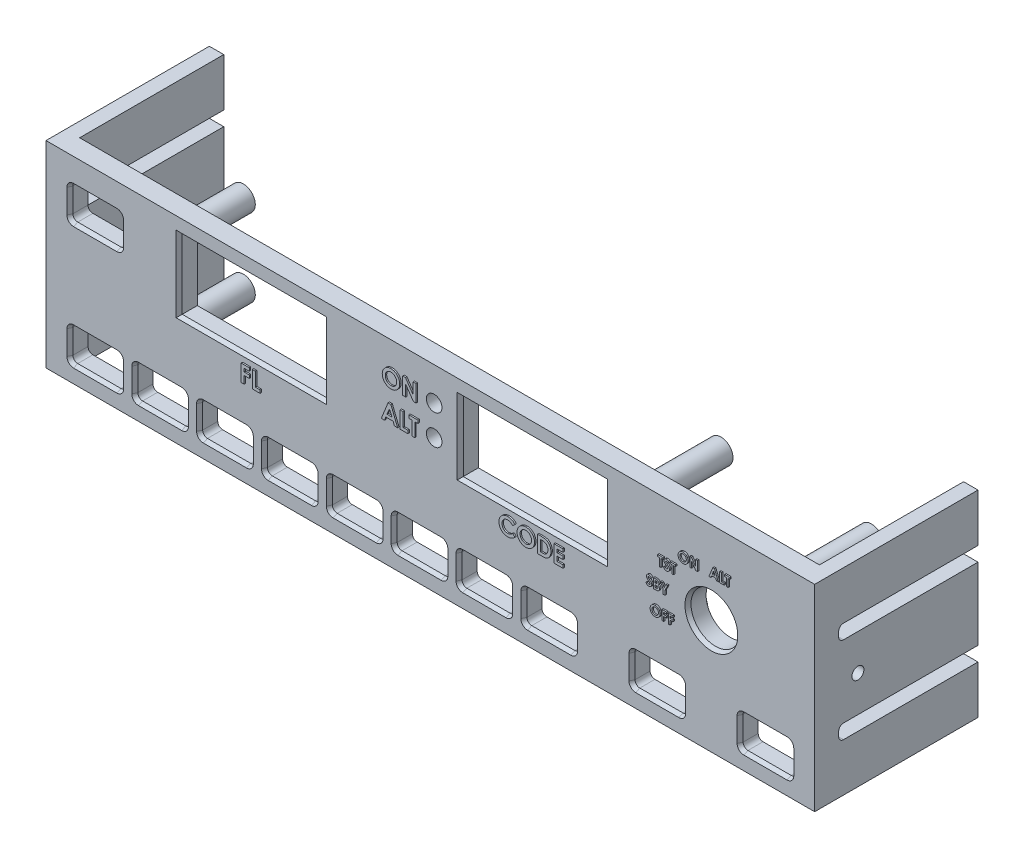
from build123d import *

# Parameters (mm, degrees)
ESQUISSE1_W             = 160
ESQUISSE1_H             = 41
BOSS_EXTRU_1_DEPTH      = 4
ESQUISSE2_R             = 5.1
ESQUISSE2_R_2           = 1.625
ESQUISSE2_W             = 30.5
ESQUISSE2_H             = 15
ENL_V_MAT_EXTRU_1_DEPTH = 4
ESQUISSE4_W             = 3
ESQUISSE4_H             = 41
BOSS_EXTRU_2_DEPTH      = 30
ENL_V_MAT_EXTRU_2_DEPTH = 168.871975029
ESQUISSE7_R             = 2.5
ESQUISSE7_R_2           = 1.25
BOSS_EXTRU_3_DEPTH      = 15
CHANFREIN1_SIZE         = 0.4
CHANFREIN1_SIZE2        = 0.857802768
ESQUISSE9_R             = 1.25
ENL_V_MAT_EXTRU_3_DEPTH = 900
ENL_V_MAT_EXTRU_4_DEPTH = 0.3
BOSS_EXTRU_4_DEPTH      = 0.3
BOSS_EXTRU_4_2_DEPTH    = 0.3
BOSS_EXTRU_4_3_DEPTH    = 0.3
BOSS_EXTRU_4_4_DEPTH    = 0.3
BOSS_EXTRU_4_5_DEPTH    = 0.3
BOSS_EXTRU_4_6_DEPTH    = 0.3
BOSS_EXTRU_4_7_DEPTH    = 0.3
BOSS_EXTRU_4_8_DEPTH    = 0.3
BOSS_EXTRU_4_9_DEPTH    = 0.3
BOSS_EXTRU_4_10_DEPTH   = 0.3
BOSS_EXTRU_4_11_DEPTH   = 0.3
BOSS_EXTRU_4_12_DEPTH   = 0.3
BOSS_EXTRU_4_13_DEPTH   = 0.3
BOSS_EXTRU_4_14_DEPTH   = 0.3
BOSS_EXTRU_4_15_DEPTH   = 0.3
BOSS_EXTRU_4_16_DEPTH   = 0.3
BOSS_EXTRU_4_17_DEPTH   = 0.3
BOSS_EXTRU_4_18_DEPTH   = 0.3
BOSS_EXTRU_4_19_DEPTH   = 0.3
BOSS_EXTRU_4_20_DEPTH   = 0.3
BOSS_EXTRU_4_21_DEPTH   = 0.3
BOSS_EXTRU_4_22_DEPTH   = 0.3
BOSS_EXTRU_4_23_DEPTH   = 0.3
BOSS_EXTRU_4_24_DEPTH   = 0.3
BOSS_EXTRU_4_25_DEPTH   = 0.3


with BuildPart() as part:
    # Esquisse1 → Boss.-Extru.1 (new body)
    with BuildSketch(Plane.XY):
        with Locations((80, 20.5)):
            Rectangle(ESQUISSE1_W, ESQUISSE1_H)
    extrude(amount=BOSS_EXTRU_1_DEPTH)

    # Esquisse2 → Enlèv. mat.-Extru.1 (cut)
    with BuildSketch(Plane.XY.offset(4)):
        with Locations((138.5, 23.75)):
            Circle(ESQUISSE2_R)
        with Locations((80.8, 34.05)):
            Circle(ESQUISSE2_R_2)
        with Locations((80.8, 27.83)):
            Circle(ESQUISSE2_R_2)
        with BuildLine():
            Line((19.25, 10.25), (28.25, 10.25))
            ThreePointArc((28.25, 10.25), (28.957106781, 9.957106781), (29.25, 9.25))
            Line((29.25, 9.25), (29.25, 4.25))
            ThreePointArc((29.25, 4.25), (28.957106781, 3.542893219), (28.25, 3.25))
            Line((28.25, 3.25), (19.25, 3.25))
            ThreePointArc((19.25, 3.25), (18.542893219, 3.542893219), (18.25, 4.25))
            Line((18.25, 4.25), (18.25, 9.25))
            ThreePointArc((18.25, 9.25), (18.542893219, 9.957106781), (19.25, 10.25))
        make_face()
        with BuildLine():
            Line((5.75, 3.25), (14.75, 3.25))
            ThreePointArc((14.75, 3.25), (15.457106781, 3.542893219), (15.75, 4.25))
            Line((15.75, 4.25), (15.75, 9.25))
            ThreePointArc((15.75, 9.25), (15.457106781, 9.957106781), (14.75, 10.25))
            Line((14.75, 10.25), (5.75, 10.25))
            ThreePointArc((5.75, 10.25), (5.042893219, 9.957106781), (4.75, 9.25))
            Line((4.75, 9.25), (4.75, 4.25))
            ThreePointArc((4.75, 4.25), (5.042893219, 3.542893219), (5.75, 3.25))
        make_face()
        with BuildLine():
            Line((32.75, 10.25), (41.75, 10.25))
            ThreePointArc((41.75, 10.25), (42.457106781, 9.957106781), (42.75, 9.25))
            Line((42.75, 9.25), (42.75, 4.25))
            ThreePointArc((42.75, 4.25), (42.457106781, 3.542893219), (41.75, 3.25))
            Line((41.75, 3.25), (32.75, 3.25))
            ThreePointArc((32.75, 3.25), (32.042893219, 3.542893219), (31.75, 4.25))
            Line((31.75, 4.25), (31.75, 9.25))
            ThreePointArc((31.75, 9.25), (32.042893219, 9.957106781), (32.75, 10.25))
        make_face()
        with BuildLine():
            Line((46.25, 10.25), (55.25, 10.25))
            ThreePointArc((55.25, 10.25), (55.957106781, 9.957106781), (56.25, 9.25))
            Line((56.25, 9.25), (56.25, 4.25))
            ThreePointArc((56.25, 4.25), (55.957106781, 3.542893219), (55.25, 3.25))
            Line((55.25, 3.25), (46.25, 3.25))
            ThreePointArc((46.25, 3.25), (45.542893219, 3.542893219), (45.25, 4.25))
            Line((45.25, 4.25), (45.25, 9.25))
            ThreePointArc((45.25, 9.25), (45.542893219, 9.957106781), (46.25, 10.25))
        make_face()
        with BuildLine():
            Line((59.75, 10.25), (68.75, 10.25))
            ThreePointArc((68.75, 10.25), (69.457106781, 9.957106781), (69.75, 9.25))
            Line((69.75, 9.25), (69.75, 4.25))
            ThreePointArc((69.75, 4.25), (69.457106781, 3.542893219), (68.75, 3.25))
            Line((68.75, 3.25), (59.75, 3.25))
            ThreePointArc((59.75, 3.25), (59.042893219, 3.542893219), (58.75, 4.25))
            Line((58.75, 4.25), (58.75, 9.25))
            ThreePointArc((58.75, 9.25), (59.042893219, 9.957106781), (59.75, 10.25))
        make_face()
        with BuildLine():
            Line((73.25, 10.25), (82.25, 10.25))
            ThreePointArc((82.25, 10.25), (82.957106781, 9.957106781), (83.25, 9.25))
            Line((83.25, 9.25), (83.25, 4.25))
            ThreePointArc((83.25, 4.25), (82.957106781, 3.542893219), (82.25, 3.25))
            Line((82.25, 3.25), (73.25, 3.25))
            ThreePointArc((73.25, 3.25), (72.542893219, 3.542893219), (72.25, 4.25))
            Line((72.25, 4.25), (72.25, 9.25))
            ThreePointArc((72.25, 9.25), (72.542893219, 9.957106781), (73.25, 10.25))
        make_face()
        with BuildLine():
            Line((86.75, 10.25), (95.75, 10.25))
            ThreePointArc((95.75, 10.25), (96.457106781, 9.957106781), (96.75, 9.25))
            Line((96.75, 9.25), (96.75, 4.25))
            ThreePointArc((96.75, 4.25), (96.457106781, 3.542893219), (95.75, 3.25))
            Line((95.75, 3.25), (86.75, 3.25))
            ThreePointArc((86.75, 3.25), (86.042893219, 3.542893219), (85.75, 4.25))
            Line((85.75, 4.25), (85.75, 9.25))
            ThreePointArc((85.75, 9.25), (86.042893219, 9.957106781), (86.75, 10.25))
        make_face()
        with BuildLine():
            Line((100.25, 10.25), (109.25, 10.25))
            ThreePointArc((109.25, 10.25), (109.957106781, 9.957106781), (110.25, 9.25))
            Line((110.25, 9.25), (110.25, 4.25))
            ThreePointArc((110.25, 4.25), (109.957106781, 3.542893219), (109.25, 3.25))
            Line((109.25, 3.25), (100.25, 3.25))
            ThreePointArc((100.25, 3.25), (99.542893219, 3.542893219), (99.25, 4.25))
            Line((99.25, 4.25), (99.25, 9.25))
            ThreePointArc((99.25, 9.25), (99.542893219, 9.957106781), (100.25, 10.25))
        make_face()
        with BuildLine():
            Line((122.75, 3.25), (131.75, 3.25))
            ThreePointArc((131.75, 3.25), (132.457106781, 3.542893219), (132.75, 4.25))
            Line((132.75, 4.25), (132.75, 9.25))
            ThreePointArc((132.75, 9.25), (132.457106781, 9.957106781), (131.75, 10.25))
            Line((131.75, 10.25), (122.75, 10.25))
            ThreePointArc((122.75, 10.25), (122.042893219, 9.957106781), (121.75, 9.25))
            Line((121.75, 9.25), (121.75, 4.25))
            ThreePointArc((121.75, 4.25), (122.042893219, 3.542893219), (122.75, 3.25))
        make_face()
        with BuildLine():
            Line((145.25, 3.25), (154.25, 3.25))
            ThreePointArc((154.25, 3.25), (154.957106781, 3.542893219), (155.25, 4.25))
            Line((155.25, 4.25), (155.25, 9.25))
            ThreePointArc((155.25, 9.25), (154.957106781, 9.957106781), (154.25, 10.25))
            Line((154.25, 10.25), (145.25, 10.25))
            ThreePointArc((145.25, 10.25), (144.542893219, 9.957106781), (144.25, 9.25))
            Line((144.25, 9.25), (144.25, 4.25))
            ThreePointArc((144.25, 4.25), (144.542893219, 3.542893219), (145.25, 3.25))
        make_face()
        with BuildLine():
            Line((5.75, 35.75), (14.75, 35.75))
            ThreePointArc((14.75, 35.75), (15.457106781, 35.457106781), (15.75, 34.75))
            Line((15.75, 34.75), (15.75, 29.75))
            ThreePointArc((15.75, 29.75), (15.457106781, 29.042893219), (14.75, 28.75))
            Line((14.75, 28.75), (5.75, 28.75))
            ThreePointArc((5.75, 28.75), (5.042893219, 29.042893219), (4.75, 29.75))
            Line((4.75, 29.75), (4.75, 34.75))
            ThreePointArc((4.75, 34.75), (5.042893219, 35.457106781), (5.75, 35.75))
        make_face()
        with Locations((42.75, 30.5)):
            Rectangle(ESQUISSE2_W, ESQUISSE2_H)
        with Locations((101.25, 30.5)):
            Rectangle(ESQUISSE2_W, ESQUISSE2_H)
    extrude(amount=-ENL_V_MAT_EXTRU_1_DEPTH, mode=Mode.SUBTRACT)

    # Esquisse4 → Boss.-Extru.2 (add)
    with BuildSketch(Plane(origin=(0, 0, 0), x_dir=(-1, 0, 0), z_dir=(0, 0, -1))):
        with Locations((-158.5, 20.5)):
            Rectangle(ESQUISSE4_W, ESQUISSE4_H)
        with Locations((-1.5, 20.5)):
            Rectangle(ESQUISSE4_W, ESQUISSE4_H)
    extrude(amount=BOSS_EXTRU_2_DEPTH)

    # Esquisse5 → Enlèv. mat.-Extru.2 (cut, through all)
    with BuildSketch(Plane(origin=(160, 0, 0), x_dir=(0, 0, -1), z_dir=(1, 0, 0))):
        with BuildLine():
            Line((30, 13), (2, 13))
            ThreePointArc((2, 13), (1.292893219, 12.707106781), (1, 12))
            Line((1, 12), (1, 11))
            ThreePointArc((1, 11), (1.292893219, 10.292893219), (2, 10))
            Line((2, 10), (30, 10))
            Line((30, 10), (30, 13))
        make_face()
        with BuildLine():
            Line((30, 31), (2, 31))
            ThreePointArc((2, 31), (1.292893219, 30.707106781), (1, 30))
            Line((1, 30), (1, 29))
            ThreePointArc((1, 29), (1.292893219, 28.292893219), (2, 28))
            Line((2, 28), (30, 28))
            Line((30, 28), (30, 31))
        make_face()
    extrude(amount=-ENL_V_MAT_EXTRU_2_DEPTH, mode=Mode.SUBTRACT)

    # Esquisse7 → Boss.-Extru.3 (add)
    # profile 1 of 7: a face of its own
    with BuildSketch(Plane(origin=(0, 0, 0), x_dir=(-1, 0, 0), z_dir=(0, 0, -1))):
        with Locations((-22.066417501, 32.220467417)):
            Circle(ESQUISSE7_R)
        with Locations((-22.066417501, 32.220467417)):
            Circle(ESQUISSE7_R_2, mode=Mode.SUBTRACT)
    # profile 2 of 7: a face of its own
    with BuildSketch(Plane(origin=(0, 0, 0), x_dir=(-1, 0, 0), z_dir=(0, 0, -1))):
        with Locations((-22.066417501, 15.960655172)):
            Circle(ESQUISSE7_R)
        with Locations((-22.066417501, 15.960655172)):
            Circle(ESQUISSE7_R_2, mode=Mode.SUBTRACT)
    # profile 3 of 7: a face of its own
    with BuildSketch(Plane(origin=(0, 0, 0), x_dir=(-1, 0, 0), z_dir=(0, 0, -1))):
        with Locations((-152.81245368, 36.297265299)):
            Circle(ESQUISSE7_R)
        with Locations((-152.81245368, 36.297265299)):
            Circle(ESQUISSE7_R_2, mode=Mode.SUBTRACT)
    # profile 4 of 7: a face of its own
    with BuildSketch(Plane(origin=(0, 0, 0), x_dir=(-1, 0, 0), z_dir=(0, 0, -1))):
        with Locations((-152.81245368, 14.495559759)):
            Circle(ESQUISSE7_R)
        with Locations((-152.81245368, 14.495559759)):
            Circle(ESQUISSE7_R_2, mode=Mode.SUBTRACT)
    # profile 5 of 7: a face of its own
    with BuildSketch(Plane(origin=(0, 0, 0), x_dir=(-1, 0, 0), z_dir=(0, 0, -1))):
        with Locations((-121.5, 36.297265299)):
            Circle(ESQUISSE7_R)
        with Locations((-121.5, 36.297265299)):
            Circle(ESQUISSE7_R_2, mode=Mode.SUBTRACT)
    # profile 6 of 7: a face of its own
    with BuildSketch(Plane(origin=(0, 0, 0), x_dir=(-1, 0, 0), z_dir=(0, 0, -1))):
        with Locations((-116.25, 6.75)):
            Circle(ESQUISSE7_R)
        with Locations((-116.25, 6.75)):
            Circle(ESQUISSE7_R_2, mode=Mode.SUBTRACT)
    # profile 7 of 7: a face of its own
    with BuildSketch(Plane(origin=(0, 0, 0), x_dir=(-1, 0, 0), z_dir=(0, 0, -1))):
        with Locations((-63.5, 14.495559759)):
            Circle(ESQUISSE7_R)
        with Locations((-63.5, 14.495559759)):
            Circle(ESQUISSE7_R_2, mode=Mode.SUBTRACT)
    extrude(amount=BOSS_EXTRU_3_DEPTH)

    # Chanfrein1
    chanfrein1_edges = [part.edges().sort_by_distance(p)[0] for p in [
        (101.25, 38, 4),
        (116.5, 30.5, 4),
        (101.25, 23, 4),
        (86, 30.5, 4),
        (58, 30.5, 4),
        (42.75, 23, 4),
        (27.5, 30.5, 4),
        (42.75, 38, 4),
        (133.4, 23.75, 4),
        (149.75, 3.25, 4),
        (154.957106781, 3.542893219, 4),
        (144.542893219, 3.542893219, 4),
        (155.25, 6.75, 4),
        (144.25, 6.75, 4),
        (154.957106781, 9.957106781, 4),
        (144.542893219, 9.957106781, 4),
        (149.75, 10.25, 4),
        (127.25, 3.25, 4),
        (132.457106781, 3.542893219, 4),
        (122.042893219, 3.542893219, 4),
        (132.75, 6.75, 4),
        (121.75, 6.75, 4),
        (132.457106781, 9.957106781, 4),
        (122.042893219, 9.957106781, 4),
        (127.25, 10.25, 4),
        (104.75, 3.25, 4),
        (109.957106781, 3.542893219, 4),
        (99.542893219, 3.542893219, 4),
        (110.25, 6.75, 4),
        (99.25, 6.75, 4),
        (109.957106781, 9.957106781, 4),
        (99.542893219, 9.957106781, 4),
        (104.75, 10.25, 4),
        (91.25, 3.25, 4),
        (96.457106781, 3.542893219, 4),
        (86.042893219, 3.542893219, 4),
        (96.75, 6.75, 4),
        (85.75, 6.75, 4),
        (96.457106781, 9.957106781, 4),
        (86.042893219, 9.957106781, 4),
        (91.25, 10.25, 4),
        (77.75, 3.25, 4),
        (82.957106781, 3.542893219, 4),
        (72.542893219, 3.542893219, 4),
        (83.25, 6.75, 4),
        (72.25, 6.75, 4),
        (82.957106781, 9.957106781, 4),
        (72.542893219, 9.957106781, 4),
        (77.75, 10.25, 4),
        (64.25, 3.25, 4),
        (69.457106781, 3.542893219, 4),
        (59.042893219, 3.542893219, 4),
        (69.75, 6.75, 4),
        (58.75, 6.75, 4),
        (69.457106781, 9.957106781, 4),
        (59.042893219, 9.957106781, 4),
        (64.25, 10.25, 4),
        (50.75, 3.25, 4),
        (55.957106781, 3.542893219, 4),
        (45.542893219, 3.542893219, 4),
        (56.25, 6.75, 4),
        (45.25, 6.75, 4),
        (55.957106781, 9.957106781, 4),
        (45.542893219, 9.957106781, 4),
        (50.75, 10.25, 4),
        (37.25, 3.25, 4),
        (42.457106781, 3.542893219, 4),
        (32.042893219, 3.542893219, 4),
        (42.75, 6.75, 4),
        (31.75, 6.75, 4),
        (42.457106781, 9.957106781, 4),
        (32.042893219, 9.957106781, 4),
        (37.25, 10.25, 4),
        (23.75, 3.25, 4),
        (28.957106781, 3.542893219, 4),
        (18.542893219, 3.542893219, 4),
        (29.25, 6.75, 4),
        (18.25, 6.75, 4),
        (28.957106781, 9.957106781, 4),
        (18.542893219, 9.957106781, 4),
        (23.75, 10.25, 4),
        (10.25, 3.25, 4),
        (15.457106781, 3.542893219, 4),
        (5.042893219, 3.542893219, 4),
        (15.75, 6.75, 4),
        (4.75, 6.75, 4),
        (15.457106781, 9.957106781, 4),
        (5.042893219, 9.957106781, 4),
        (10.25, 10.25, 4),
        (10.25, 35.75, 4),
        (5.042893219, 35.457106781, 4),
        (15.457106781, 35.457106781, 4),
        (4.75, 32.25, 4),
        (15.75, 32.25, 4),
        (5.042893219, 29.042893219, 4),
        (15.457106781, 29.042893219, 4),
        (10.25, 28.75, 4),
    ]]
    chanfrein1_side = [part.faces().sort_by_distance(p)[0] for p in [
        (82.682937433, 20.497031932, 4),
    ]]
    chamfer(chanfrein1_edges, length=CHANFREIN1_SIZE, length2=CHANFREIN1_SIZE2, reference=chanfrein1_side[0])

    # Esquisse9 → Enlèv. mat.-Extru.3 (cut)
    with BuildSketch(Plane(origin=(160, 0, 0), x_dir=(0, 0, -1), z_dir=(1, 0, 0))):
        with Locations((5, 20.5)):
            Circle(ESQUISSE9_R)
    extrude(amount=-ENL_V_MAT_EXTRU_3_DEPTH, mode=Mode.SUBTRACT)

    # Esquisse8 → Enlèv. mat.-Extru.4 (cut)
    # profile 1 of 25: a face of its own
    with BuildSketch(Plane.XY.offset(4)):
        Polygon((129.825536536, 20.885193728), (130.799895511, 20.885193728), (130.799895511, 20.526219369), (130.184510895, 20.526219369), (130.184510895, 20.141603984), (130.799895511, 20.141603984), (130.799895511, 19.782629625), (130.184510895, 19.782629625), (130.184510895, 18.885193728), (129.825536536, 18.885193728), align=None)
    # profile 2 of 25: a face of its own
    with BuildSketch(Plane.XY.offset(4)):
        Polygon((128.492203203, 20.885193728), (129.466562177, 20.885193728), (129.466562177, 20.526219369), (128.851177562, 20.526219369), (128.851177562, 20.141603984), (129.466562177, 20.141603984), (129.466562177, 19.782629625), (128.851177562, 19.782629625), (128.851177562, 18.885193728), (128.492203203, 18.885193728), align=None)
    # profile 3 of 25: a face of its own
    with BuildSketch(Plane.XY.offset(4)):
        with BuildLine():
            add(Edge.make_bspline(
                [(127.098773716, 20.936475779), (127.133546167, 20.935575458), (127.202194861, 20.933798021), (127.303152318, 20.918981691), (127.400443494, 20.894840605), (127.494024396, 20.86128275), (127.583660706, 20.817399209), (127.669668603, 20.764434108), (127.751740011, 20.701387763), (127.829033926, 20.629730941), (127.900467445, 20.551807276), (127.96236463, 20.467908597), (128.015148279, 20.380208803), (128.058895508, 20.2884729), (128.092217166, 20.192065573), (128.115600352, 20.091478371), (128.13062289, 19.986739912), (128.132350713, 19.915427297), (128.133228844, 19.879184112)],
                knots=[0, 0, 0, 0, 1.014329547, 2.002516266, 2.970391464, 3.935626869, 4.897733899, 5.877609409, 6.878433252, 7.912639331, 8.949961323, 9.958554974, 10.949718813, 11.932905612, 12.9188844, 13.919928257, 14.942845884, 16, 16, 16, 16], degree=3))
            add(Edge.make_bspline(
                [(128.133228844, 19.879184112), (128.132293673, 19.843349305), (128.130450887, 19.772735667), (128.116213638, 19.668962413), (128.092436676, 19.56945271), (128.05968018, 19.473981315), (128.01672636, 19.383010659), (127.964972049, 19.295959906), (127.903051551, 19.213636909), (127.833223349, 19.136085844), (127.756348557, 19.065691613), (127.67492595, 19.003656818), (127.589331485, 18.951090873), (127.499690447, 18.908017858), (127.405810603, 18.874590476), (127.307923849, 18.85100503), (127.206036242, 18.836671678), (127.136747728, 18.834840929), (127.101578203, 18.833911677)],
                knots=[0, 0, 0, 0, 1.051557043, 2.072126891, 3.067553643, 4.050577992, 5.02905126, 6.015227836, 7.017913613, 8.04756643, 9.074058332, 10.072836633, 11.047628519, 12.017157415, 12.98668631, 13.966869689, 14.968021931, 16, 16, 16, 16], degree=3))
            add(Edge.make_bspline(
                [(127.101578203, 18.833911677), (127.064795097, 18.834745262), (126.992521322, 18.836383144), (126.886748328, 18.851958652), (126.785408661, 18.875420808), (126.689353631, 18.910436818), (126.597605001, 18.954209774), (126.510836874, 19.008118794), (126.42907841, 19.072074789), (126.35279859, 19.144439823), (126.283688888, 19.223623041), (126.22268602, 19.307273089), (126.171228748, 19.394750955), (126.129315189, 19.486097579), (126.096272222, 19.580745264), (126.072964163, 19.679270443), (126.059195537, 19.781436817), (126.057277647, 19.85083026), (126.056305767, 19.88599501)],
                knots=[0, 0, 0, 0, 1.067978421, 2.098431617, 3.099715153, 4.085208694, 5.062210972, 6.048429807, 7.046490867, 8.072918869, 9.098532598, 10.095778865, 11.076610158, 12.041847152, 13.011192615, 13.984257998, 14.978533688, 16, 16, 16, 16], degree=3))
            add(Edge.make_bspline(
                [(126.056305767, 19.88599501), (126.056610799, 19.909652013), (126.057217001, 19.956666467), (126.064519337, 20.026339489), (126.075032603, 20.094652587), (126.090581223, 20.161333395), (126.109468823, 20.226852317), (126.133940376, 20.290599485), (126.161795627, 20.353255894), (126.194341864, 20.414081495), (126.230530134, 20.472516641), (126.270014757, 20.528285682), (126.312895019, 20.58071429), (126.359032787, 20.630147004), (126.408587059, 20.676258898), (126.460905999, 20.719702752), (126.51700429, 20.759324542), (126.575654116, 20.796091911), (126.636524823, 20.829340005), (126.699368613, 20.857639788), (126.762890779, 20.882353507), (126.827939891, 20.901858666), (126.893818832, 20.917745415), (126.961231386, 20.928251594), (127.029568519, 20.935553728), (127.075650571, 20.936167699), (127.098773716, 20.936475779)],
                knots=[0, 0, 0, 0, 1.034744296, 2.056386356, 3.06226378, 4.057406941, 5.050368692, 6.043467995, 7.042652155, 8.049140477, 9.059438543, 10.048523776, 11.036952808, 12.020949711, 13.004946614, 13.997082645, 14.994316842, 16.007702937, 17.024872941, 18.026463647, 19.021641123, 20.005082605, 20.995858141, 21.984425357, 22.988620895, 24, 24, 24, 24], degree=3))
        make_face()
        with BuildLine():
            add(Edge.make_bspline(
                [(127.093164741, 20.57750142), (127.069762886, 20.576873496), (127.023576989, 20.575634225), (126.955830689, 20.566192653), (126.890791849, 20.551113391), (126.828821004, 20.529271263), (126.769649567, 20.501471778), (126.713172647, 20.467812071), (126.660172331, 20.427135126), (126.609941911, 20.381624708), (126.564566993, 20.330915643), (126.524476821, 20.276572257), (126.490927804, 20.2186853), (126.462830292, 20.15779253), (126.441679093, 20.093209224), (126.426613728, 20.025441269), (126.41709298, 19.954371898), (126.415892878, 19.905924001), (126.415280126, 19.881187318)],
                knots=[0, 0, 0, 0, 1.033739768, 2.040188636, 3.016340934, 3.979330865, 4.937572243, 5.900995986, 6.878200029, 7.884839167, 8.891893314, 9.879764717, 10.863503415, 11.843163062, 12.837761627, 13.859916423, 14.907309254, 16, 16, 16, 16], degree=3))
            add(Edge.make_bspline(
                [(126.415280126, 19.881187318), (126.416092542, 19.853773508), (126.417684742, 19.800046984), (126.428887654, 19.721672178), (126.448054723, 19.647654953), (126.475731597, 19.578357315), (126.510058183, 19.513009767), (126.552686354, 19.452413234), (126.602925736, 19.396204895), (126.641629749, 19.363388125), (126.661273716, 19.346732189)],
                knots=[0, 0, 0, 0, 1.078454662, 2.113592447, 3.107694534, 4.079536787, 5.043276885, 6.005368276, 6.987637804, 8, 8, 8, 8], degree=3))
            add(Edge.make_bspline(
                [(126.661273716, 19.346732189), (126.677365875, 19.334427424), (126.709187634, 19.310095122), (126.75998209, 19.278908285), (126.812290378, 19.252178054), (126.866507229, 19.230580344), (126.92251814, 19.213591948), (126.980315431, 19.201695254), (127.039817207, 19.19422905), (127.080055096, 19.193336697), (127.10037628, 19.192886036)],
                knots=[0, 0, 0, 0, 1.023928204, 2.024787132, 3.009472467, 3.9914905, 4.972207045, 5.96565515, 6.972602802, 8, 8, 8, 8], degree=3))
            add(Edge.make_bspline(
                [(127.10037628, 19.192886036), (127.123375739, 19.193519284), (127.168627899, 19.19476522), (127.235113065, 19.204090561), (127.298807874, 19.219872403), (127.360107747, 19.241522924), (127.418835925, 19.269671456), (127.474705385, 19.304375181), (127.527814082, 19.345207985), (127.577980509, 19.391316054), (127.623834994, 19.442224878), (127.663841507, 19.496858127), (127.698457214, 19.554012067), (127.725970438, 19.614495626), (127.747957273, 19.677737868), (127.762841318, 19.744018878), (127.772442495, 19.813065421), (127.773642936, 19.860054034), (127.774254485, 19.883991805)],
                knots=[0, 0, 0, 0, 1.026359118, 2.019393844, 2.989460624, 3.950973911, 4.916101784, 5.890408035, 6.881132271, 7.902007068, 8.92769091, 9.933912415, 10.920395702, 11.90457117, 12.894218921, 13.903490204, 14.931958862, 16, 16, 16, 16], degree=3))
            add(Edge.make_bspline(
                [(127.774254485, 19.883991805), (127.773621776, 19.907791927), (127.772376384, 19.954638838), (127.763034631, 20.023507863), (127.747352872, 20.089496262), (127.725637337, 20.152711801), (127.697907749, 20.213216454), (127.6636173, 20.270797452), (127.622886311, 20.325399127), (127.576652204, 20.376649391), (127.52632922, 20.4237451), (127.472302468, 20.464615615), (127.416083678, 20.500130792), (127.356382916, 20.527951949), (127.294421611, 20.550117005), (127.229821669, 20.56643967), (127.162338416, 20.575567897), (127.116428164, 20.576851168), (127.093164741, 20.57750142)],
                knots=[0, 0, 0, 0, 1.055025985, 2.07665775, 3.074803781, 4.057872707, 5.035505728, 6.020516407, 7.023567878, 8.050795229, 9.077271434, 10.074415901, 11.050397877, 12.019801805, 12.988065821, 13.964604439, 14.968634123, 16, 16, 16, 16], degree=3))
        make_face(mode=Mode.SUBTRACT)
    # profile 4 of 25: a face of its own
    with BuildSketch(Plane.XY.offset(4)):
        with BuildLine():
            Line((126.343168247, 25.482772436), (126.07473876, 25.237179487))
            add(Edge.make_bspline(
                [(126.07473876, 25.237179487), (126.063240392, 25.253399131), (126.041165128, 25.284538585), (126.005383429, 25.326235048), (125.969763302, 25.361805234), (125.933974749, 25.391100547), (125.897700554, 25.413942997), (125.861003683, 25.430115703), (125.824092181, 25.440396846), (125.79929335, 25.441677096), (125.787078504, 25.442307692)],
                knots=[0, 0, 0, 0, 1.299362458, 2.494594718, 3.587462134, 4.587049575, 5.512617175, 6.380583204, 7.202344345, 8, 8, 8, 8], degree=3))
            add(Edge.make_bspline(
                [(125.787078504, 25.442307692), (125.775684845, 25.441908118), (125.753686684, 25.441136644), (125.722326673, 25.43346825), (125.694484808, 25.420233729), (125.670188263, 25.402928479), (125.650941815, 25.382079664), (125.635575018, 25.360214619), (125.62692222, 25.336080553), (125.625783342, 25.319504304), (125.625219529, 25.311298077)],
                knots=[0, 0, 0, 0, 1.185010067, 2.2879431, 3.333075148, 4.379039566, 5.372662701, 6.27520591, 7.14612461, 8, 8, 8, 8], degree=3))
            add(Edge.make_bspline(
                [(125.625219529, 25.311298077), (125.625572842, 25.302973513), (125.626284365, 25.286208997), (125.633156704, 25.261638511), (125.643515282, 25.237630287), (125.653413325, 25.223015338), (125.658472734, 25.215544872)],
                knots=[0, 0, 0, 0, 0.967525499, 1.948461899, 2.951351359, 4, 4, 4, 4], degree=3))
            add(Edge.make_bspline(
                [(125.658472734, 25.215544872), (125.663072285, 25.209738157), (125.673659841, 25.196371865), (125.693848144, 25.175201743), (125.719200412, 25.14926649), (125.750692254, 25.119457943), (125.787016357, 25.084704072), (125.82985639, 25.046371064), (125.877979231, 25.003271789), (125.912183831, 24.973259015), (125.93010735, 24.957532051)],
                knots=[0, 0, 0, 0, 0.473873513, 1.090794244, 1.870441696, 2.795289791, 3.865433203, 5.087734844, 6.473946851, 8, 8, 8, 8], degree=3))
            add(Edge.make_bspline(
                [(125.93010735, 24.957532051), (125.94693115, 24.942971901), (125.978859228, 24.91533976), (126.024286542, 24.876120373), (126.064209585, 24.840835647), (126.099209945, 24.810015129), (126.128757051, 24.783335443), (126.152975118, 24.76066906), (126.172159929, 24.742457252), (126.183065371, 24.731457309), (126.187719529, 24.726762821)],
                knots=[0, 0, 0, 0, 1.543621617, 2.929473131, 4.163658386, 5.240097082, 6.164993805, 6.925417477, 7.541396219, 8, 8, 8, 8], degree=3))
            add(Edge.make_bspline(
                [(126.187719529, 24.726762821), (126.205376435, 24.707654267), (126.239319208, 24.670920917), (126.283432847, 24.613995777), (126.319739799, 24.558425234), (126.347827546, 24.503163636), (126.369040542, 24.44741367), (126.383995985, 24.38980807), (126.392952899, 24.329744893), (126.393947326, 24.288759108), (126.394450299, 24.268028846)],
                knots=[0, 0, 0, 0, 1.206664779, 2.319633467, 3.337109185, 4.282041471, 5.190008762, 6.099243693, 7.03861361, 8, 8, 8, 8], degree=3))
            add(Edge.make_bspline(
                [(126.394450299, 24.268028846), (126.394092296, 24.247829748), (126.39338988, 24.208198366), (126.384786642, 24.150203742), (126.372518928, 24.09470037), (126.353550891, 24.042292204), (126.33043276, 23.992118982), (126.301450844, 23.944962242), (126.267415557, 23.900344738), (126.228405893, 23.859064064), (126.185256571, 23.821604713), (126.138974824, 23.788257514), (126.089108083, 23.760725154), (126.036082403, 23.738054219), (125.979926168, 23.720592762), (125.920706275, 23.707687118), (125.858332145, 23.699941354), (125.815679816, 23.699131626), (125.793889401, 23.698717949)],
                knots=[0, 0, 0, 0, 1.043214005, 2.046824704, 3.02475056, 3.976699089, 4.921714032, 5.875962561, 6.831408892, 7.817874052, 8.806269674, 9.781291748, 10.760897367, 11.74438705, 12.757449933, 13.795994037, 14.874007457, 16, 16, 16, 16], degree=3))
            add(Edge.make_bspline(
                [(125.793889401, 23.698717949), (125.776784111, 23.699021408), (125.742905827, 23.699622431), (125.692974357, 23.704529287), (125.644759879, 23.712448429), (125.598316701, 23.723798925), (125.55343559, 23.738181544), (125.510114701, 23.755749362), (125.468653092, 23.776774673), (125.428737047, 23.800825114), (125.390560607, 23.828750844), (125.353641044, 23.859980931), (125.318345079, 23.894995707), (125.284503193, 23.933712363), (125.252331916, 23.976240537), (125.220778167, 24.021987944), (125.191244288, 24.071803594), (125.172999898, 24.106749676), (125.163681068, 24.124599359)],
                knots=[0, 0, 0, 0, 1.016823716, 2.013894106, 2.979844003, 3.91962641, 4.853723003, 5.779685073, 6.695824784, 7.614987388, 8.547259901, 9.504950863, 10.487499108, 11.500346958, 12.559593716, 13.656357062, 14.802919212, 16, 16, 16, 16], degree=3))
            Line((125.163681068, 24.124599359), (125.479386196, 24.314102564))
            add(Edge.make_bspline(
                [(125.479386196, 24.314102564), (125.491042659, 24.293840842), (125.513389095, 24.254997389), (125.551257221, 24.202806287), (125.590051182, 24.158113247), (125.63066786, 24.121708221), (125.672613373, 24.093104429), (125.716090326, 24.072662175), (125.761129265, 24.060008442), (125.791807744, 24.058463129), (125.807110555, 24.057692308)],
                knots=[0, 0, 0, 0, 1.283663364, 2.460892379, 3.537111102, 4.529833553, 5.449777664, 6.316464042, 7.160231139, 8, 8, 8, 8], degree=3))
            add(Edge.make_bspline(
                [(125.807110555, 24.057692308), (125.822675704, 24.058321802), (125.85287436, 24.059543114), (125.895979078, 24.070823998), (125.935499115, 24.088535813), (125.969659943, 24.113808132), (125.998585178, 24.142976228), (126.019933662, 24.175427069), (126.033344924, 24.210538096), (126.034762819, 24.234928525), (126.03547594, 24.247195513)],
                knots=[0, 0, 0, 0, 1.13588714, 2.203786484, 3.234766741, 4.283437687, 5.291419208, 6.222934724, 7.106237994, 8, 8, 8, 8], degree=3))
            add(Edge.make_bspline(
                [(126.03547594, 24.247195513), (126.034817402, 24.258607949), (126.033479647, 24.281791221), (126.023626152, 24.316261017), (126.008222134, 24.350715138), (125.989998095, 24.37897534), (125.971452853, 24.402636841), (125.953719419, 24.423138461), (125.932124787, 24.445789163), (125.906723712, 24.470617438), (125.877851809, 24.497841856), (125.845484756, 24.527459752), (125.809251916, 24.559210227), (125.783642474, 24.580838337), (125.770251581, 24.592147436)],
                knots=[0, 0, 0, 0, 0.916159276, 1.861089862, 2.860218735, 3.940849679, 4.552606315, 5.27541173, 6.11797699, 7.06649574, 8.129236253, 9.306560635, 10.591630461, 12, 12, 12, 12], degree=3))
            add(Edge.make_bspline(
                [(125.770251581, 24.592147436), (125.74479496, 24.613686178), (125.695935999, 24.655025544), (125.626892089, 24.716082486), (125.564677344, 24.773145792), (125.509829118, 24.826920891), (125.461648558, 24.876414681), (125.420461965, 24.922029169), (125.386721793, 24.964116208), (125.351217536, 25.013965489), (125.317481394, 25.074710264), (125.288323794, 25.14779327), (125.269407573, 25.220867003), (125.267288274, 25.269924682), (125.26624517, 25.294070513)],
                knots=[0, 0, 0, 0, 1.345494975, 2.582412109, 3.71882943, 4.751509156, 5.681369928, 6.505683931, 7.230279997, 7.856715994, 8.973648664, 10.023341002, 11.027102913, 12, 12, 12, 12], degree=3))
            add(Edge.make_bspline(
                [(125.26624517, 25.294070513), (125.266678996, 25.31119344), (125.267533678, 25.344927446), (125.27515758, 25.394528386), (125.286551791, 25.442389125), (125.303099456, 25.488335047), (125.324576328, 25.5323086), (125.350659155, 25.574525056), (125.381752953, 25.614595862), (125.416793564, 25.652494455), (125.455399347, 25.687129457), (125.496654532, 25.717698316), (125.54032561, 25.743517218), (125.586145426, 25.764935873), (125.634397904, 25.781330493), (125.684727572, 25.792951816), (125.737206618, 25.799863809), (125.772901732, 25.800803414), (125.791084914, 25.801282051)],
                knots=[0, 0, 0, 0, 1.010766082, 1.991317756, 2.957454644, 3.913069143, 4.869106762, 5.843196583, 6.838735724, 7.860187025, 8.887984031, 9.89767229, 10.887916223, 11.879572884, 12.879850636, 13.892031539, 14.926195476, 16, 16, 16, 16], degree=3))
            add(Edge.make_bspline(
                [(125.791084914, 25.801282051), (125.814649418, 25.800420012), (125.861592417, 25.798702737), (125.930998995, 25.785274208), (125.998792438, 25.764156432), (126.053421665, 25.738680159), (126.096889121, 25.714001281), (126.130202866, 25.691280079), (126.164101394, 25.665251721), (126.198858077, 25.635834185), (126.233827081, 25.602473205), (126.270002742, 25.565962967), (126.306892123, 25.525987936), (126.330864372, 25.497429959), (126.343168247, 25.482772436)],
                knots=[0, 0, 0, 0, 1.282922637, 2.555718331, 3.837320111, 5.142675274, 5.830281639, 6.55870424, 7.337177975, 8.157850921, 9.037902056, 9.96903443, 10.957596896, 12, 12, 12, 12], degree=3))
        make_face()
    # profile 5 of 25: a face of its own
    with BuildSketch(Plane.XY.offset(4)):
        with BuildLine():
            Line((126.753424658, 23.75), (126.753424658, 25.75))
            Line((126.753424658, 25.75), (127.073937478, 25.75))
            add(Edge.make_bspline(
                [(127.073937478, 25.75), (127.09637538, 25.750002561), (127.139792294, 25.750007516), (127.20243157, 25.74780783), (127.260524208, 25.74496229), (127.313885336, 25.741778793), (127.362605777, 25.73629299), (127.406611445, 25.730511554), (127.445990262, 25.723539498), (127.470336044, 25.717285348), (127.481790042, 25.714342949)],
                knots=[0, 0, 0, 0, 1.311965854, 2.538629056, 3.664479157, 4.713267157, 5.663616078, 6.530575999, 7.308677837, 8, 8, 8, 8], degree=3))
            add(Edge.make_bspline(
                [(127.481790042, 25.714342949), (127.496830304, 25.710192642), (127.526344126, 25.702048407), (127.568617338, 25.685600773), (127.608719377, 25.667318062), (127.646601278, 25.646460908), (127.682030432, 25.622777506), (127.714872197, 25.596079899), (127.745834886, 25.567439727), (127.773819088, 25.536058797), (127.799112195, 25.502899031), (127.82108737, 25.467969118), (127.840180981, 25.431803159), (127.85546087, 25.393946031), (127.86697398, 25.354572074), (127.875394621, 25.313849423), (127.880852336, 25.27164922), (127.881368019, 25.242939043), (127.881629786, 25.228365385)],
                knots=[0, 0, 0, 0, 1.099996261, 2.158545794, 3.195537121, 4.207578794, 5.205712374, 6.197378256, 7.190519799, 8.17788031, 9.159561366, 10.129234751, 11.085776129, 12.040971148, 13.00380137, 13.975669004, 14.972423361, 16, 16, 16, 16], degree=3))
            add(Edge.make_bspline(
                [(127.881629786, 25.228365385), (127.880945342, 25.209642059), (127.8795981, 25.172787494), (127.870991823, 25.118654806), (127.854853714, 25.067491635), (127.83373739, 25.018355063), (127.805025791, 24.97142837), (127.768567613, 24.926733869), (127.72495336, 24.882895348), (127.69149882, 24.856617112), (127.674097734, 24.842948718)],
                knots=[0, 0, 0, 0, 0.986156485, 1.941127874, 2.875419072, 3.804401753, 4.751181392, 5.761612777, 6.835722519, 8, 8, 8, 8], degree=3))
            add(Edge.make_bspline(
                [(127.674097734, 24.842948718), (127.688198739, 24.835750277), (127.715846909, 24.821636127), (127.755099187, 24.798436676), (127.791442511, 24.773761118), (127.825039835, 24.748105935), (127.855186416, 24.720383566), (127.883127056, 24.692191413), (127.90748331, 24.661914182), (127.929263407, 24.630631011), (127.948194312, 24.597888916), (127.964681044, 24.563743192), (127.978606794, 24.528077189), (127.99039948, 24.491072419), (127.999194469, 24.452601601), (128.004928988, 24.412650978), (128.009319694, 24.371356802), (128.00966125, 24.34322824), (128.009834914, 24.328926282)],
                knots=[0, 0, 0, 0, 1.164658916, 2.283573913, 3.35186032, 4.395461096, 5.390182219, 6.362969632, 7.312859996, 8.245001507, 9.165155236, 10.092416118, 11.032087915, 11.979892451, 12.947605196, 13.931445124, 14.948243989, 16, 16, 16, 16], degree=3))
            add(Edge.make_bspline(
                [(128.009834914, 24.328926282), (128.008707951, 24.301610361), (128.006483895, 24.2477025), (127.990222684, 24.168553379), (127.962030909, 24.093512834), (127.924175169, 24.022879107), (127.877529615, 23.958696929), (127.823900603, 23.902473899), (127.763828056, 23.854882352), (127.70840387, 23.82276175), (127.660466314, 23.801205822), (127.620760532, 23.787878588), (127.578117364, 23.775532259), (127.531755689, 23.766862412), (127.482515982, 23.758926814), (127.429918151, 23.754027212), (127.374060502, 23.750706872), (127.335695054, 23.750240388), (127.315924658, 23.75)],
                knots=[0, 0, 0, 0, 1.284142165, 2.534249414, 3.780121997, 5.041676246, 6.291546858, 7.49970053, 8.684500223, 9.883330709, 10.50184324, 11.153274765, 11.851151195, 12.587658647, 13.369265475, 14.195992086, 15.070362669, 16, 16, 16, 16], degree=3))
            Line((127.315924658, 23.75), (126.753424658, 23.75))
        make_face()
        with BuildLine():
            Line((127.112399016, 25.391025641), (127.112399016, 24.955128205))
            Line((127.112399016, 24.955128205), (127.207751581, 24.955128205))
            add(Edge.make_bspline(
                [(127.207751581, 24.955128205), (127.220710851, 24.955241215), (127.245727938, 24.955459373), (127.281862466, 24.958269179), (127.315461741, 24.963062881), (127.34639833, 24.969751301), (127.374960417, 24.97824462), (127.400965539, 24.988463912), (127.424299356, 25.000932559), (127.451407856, 25.019505159), (127.480063495, 25.04683557), (127.505288731, 25.086320013), (127.520146227, 25.131726972), (127.521800951, 25.163751475), (127.522655427, 25.180288462)],
                knots=[0, 0, 0, 0, 1.065314748, 2.056525647, 2.977365736, 3.853934255, 4.656397591, 5.425096493, 6.14721249, 6.826394842, 8.123232004, 9.372140726, 10.643011755, 12, 12, 12, 12], degree=3))
            add(Edge.make_bspline(
                [(127.522655427, 25.180288462), (127.52197169, 25.195778097), (127.520649712, 25.225726686), (127.505690124, 25.267777171), (127.482454926, 25.305042507), (127.45502251, 25.330547582), (127.429189559, 25.347966796), (127.407069801, 25.359436607), (127.382791706, 25.369704265), (127.355885275, 25.377555166), (127.32650416, 25.383446205), (127.29479108, 25.387772469), (127.26069132, 25.390717107), (127.237138544, 25.39092059), (127.224979145, 25.391025641)],
                knots=[0, 0, 0, 0, 1.347982417, 2.606269829, 3.849316587, 5.153353503, 5.842674298, 6.568177932, 7.326619318, 8.142485038, 9.012069166, 9.942760135, 10.937925643, 12, 12, 12, 12], degree=3))
            Line((127.224979145, 25.391025641), (127.112399016, 25.391025641))
        make_face(mode=Mode.SUBTRACT)
        with BuildLine():
            Line((127.112399016, 24.621794872), (127.112399016, 24.108974359))
            Line((127.112399016, 24.108974359), (127.215764401, 24.108974359))
            add(Edge.make_bspline(
                [(127.215764401, 24.108974359), (127.236199869, 24.109091106), (127.275489607, 24.109315567), (127.331772086, 24.112027587), (127.382946931, 24.116915526), (127.428878546, 24.123017724), (127.469637285, 24.131285248), (127.505085374, 24.141796345), (127.535708937, 24.153360382), (127.561324354, 24.167643341), (127.582250683, 24.184265164), (127.6011345, 24.201253066), (127.616531188, 24.220850216), (127.628713335, 24.242215362), (127.639256961, 24.264817779), (127.645616132, 24.289540084), (127.650457782, 24.315649566), (127.650724231, 24.33370893), (127.650860555, 24.342948718)],
                knots=[0, 0, 0, 0, 1.753078804, 3.370512758, 4.83203934, 6.162291463, 7.344201807, 8.395507345, 9.331626367, 10.147333109, 10.898971645, 11.62040215, 12.321813352, 13.025280112, 13.727906689, 14.453419512, 15.208716525, 16, 16, 16, 16], degree=3))
            add(Edge.make_bspline(
                [(127.650860555, 24.342948718), (127.650559921, 24.353514561), (127.649974366, 24.374093981), (127.645192131, 24.404173), (127.636501249, 24.43225376), (127.62555466, 24.459054324), (127.610321898, 24.483615139), (127.592218282, 24.50678616), (127.570344492, 24.527782746), (127.545746139, 24.547874848), (127.517054596, 24.565466573), (127.484256401, 24.58073051), (127.447173377, 24.593478388), (127.405690655, 24.603628257), (127.359990092, 24.61224231), (127.309738124, 24.617385851), (127.255353268, 24.621211328), (127.217641923, 24.621595937), (127.198136196, 24.621794872)],
                knots=[0, 0, 0, 0, 0.845221588, 1.646264278, 2.427170338, 3.19324141, 3.95557735, 4.731569926, 5.540061037, 6.376114724, 7.268642756, 8.224665384, 9.265483498, 10.400594375, 11.639216012, 12.983232105, 14.439614077, 16, 16, 16, 16], degree=3))
            Line((127.198136196, 24.621794872), (127.112399016, 24.621794872))
        make_face(mode=Mode.SUBTRACT)
    # profile 6 of 25: a face of its own
    with BuildSketch(Plane.XY.offset(4)):
        Polygon((128.202142606, 25.75), (128.601581709, 25.75), (128.958552863, 25.048477564), (129.315524016, 25.75), (129.714963119, 25.75), (129.138040042, 24.616185897), (129.138040042, 23.75), (128.779065683, 23.75), (128.779065683, 24.616185897), align=None)
    # profile 7 of 25: a face of its own
    with BuildSketch(Plane.XY.offset(4)):
        Polygon((130.220556586, 30.344539257), (131.297479663, 30.344539257), (131.297479663, 29.985564898), (130.938505304, 29.985564898), (130.938505304, 28.344539257), (130.579530945, 28.344539257), (130.579530945, 29.985564898), (130.220556586, 29.985564898), align=None)
    # profile 8 of 25: a face of its own
    with BuildSketch(Plane.XY.offset(4)):
        with BuildLine():
            Line((130.015428381, 30.077311693), (129.746998894, 29.831718744))
            add(Edge.make_bspline(
                [(129.746998894, 29.831718744), (129.735500526, 29.847938388), (129.713425262, 29.879077842), (129.677643563, 29.920774305), (129.642023436, 29.956344491), (129.606234883, 29.985639804), (129.569960688, 30.008482254), (129.533263817, 30.02465496), (129.496352315, 30.034936103), (129.471553484, 30.036216353), (129.459338638, 30.036846949)],
                knots=[0, 0, 0, 0, 1.299362458, 2.494594718, 3.587462134, 4.587049575, 5.512617175, 6.380583204, 7.202344345, 8, 8, 8, 8], degree=3))
            add(Edge.make_bspline(
                [(129.459338638, 30.036846949), (129.447944979, 30.036447375), (129.425946818, 30.035675901), (129.394586807, 30.028007507), (129.366744942, 30.014772986), (129.342448397, 29.997467736), (129.323201948, 29.976618921), (129.307835152, 29.954753876), (129.299182354, 29.93061981), (129.298043476, 29.914043561), (129.297479663, 29.905837334)],
                knots=[0, 0, 0, 0, 1.185010067, 2.2879431, 3.333075148, 4.379039566, 5.372662701, 6.27520591, 7.14612461, 8, 8, 8, 8], degree=3))
            add(Edge.make_bspline(
                [(129.297479663, 29.905837334), (129.297832976, 29.89751277), (129.298544498, 29.880748254), (129.305416838, 29.856177768), (129.315775415, 29.832169544), (129.325673459, 29.817554595), (129.330732868, 29.810084129)],
                knots=[0, 0, 0, 0, 0.967525499, 1.948461899, 2.951351359, 4, 4, 4, 4], degree=3))
            add(Edge.make_bspline(
                [(129.330732868, 29.810084129), (129.335332418, 29.804277414), (129.345919975, 29.790911122), (129.366108278, 29.769741), (129.391460545, 29.743805747), (129.422952387, 29.7139972), (129.459276491, 29.679243329), (129.502116524, 29.640910321), (129.550239365, 29.597811046), (129.584443965, 29.567798272), (129.602367484, 29.552071308)],
                knots=[0, 0, 0, 0, 0.473873513, 1.090794244, 1.870441696, 2.795289791, 3.865433203, 5.087734844, 6.473946851, 8, 8, 8, 8], degree=3))
            add(Edge.make_bspline(
                [(129.602367484, 29.552071308), (129.619191284, 29.537511158), (129.651119362, 29.509879017), (129.696546676, 29.47065963), (129.736469719, 29.435374904), (129.771470079, 29.404554386), (129.801017185, 29.3778747), (129.825235252, 29.355208317), (129.844420063, 29.336996509), (129.855325505, 29.325996566), (129.859979663, 29.321302078)],
                knots=[0, 0, 0, 0, 1.543621617, 2.929473131, 4.163658386, 5.240097082, 6.164993805, 6.925417477, 7.541396219, 8, 8, 8, 8], degree=3))
            add(Edge.make_bspline(
                [(129.859979663, 29.321302078), (129.877636569, 29.302193524), (129.911579342, 29.265460174), (129.955692981, 29.208535034), (129.991999933, 29.152964491), (130.02008768, 29.097702893), (130.041300676, 29.041952927), (130.056256119, 28.984347327), (130.065213033, 28.92428415), (130.06620746, 28.883298365), (130.066710432, 28.862568103)],
                knots=[0, 0, 0, 0, 1.206664779, 2.319633467, 3.337109185, 4.282041471, 5.190008762, 6.099243693, 7.03861361, 8, 8, 8, 8], degree=3))
            add(Edge.make_bspline(
                [(130.066710432, 28.862568103), (130.066352429, 28.842369005), (130.065650014, 28.802737623), (130.057046776, 28.744742999), (130.044779062, 28.689239627), (130.025811025, 28.636831461), (130.002692894, 28.586658239), (129.973710978, 28.539501499), (129.939675691, 28.494883995), (129.900666027, 28.453603321), (129.857516705, 28.41614397), (129.811234958, 28.382796771), (129.761368217, 28.355264411), (129.708342537, 28.332593476), (129.652186302, 28.315132019), (129.592966409, 28.302226375), (129.530592279, 28.294480611), (129.48793995, 28.293670883), (129.466149535, 28.293257206)],
                knots=[0, 0, 0, 0, 1.043214005, 2.046824704, 3.02475056, 3.976699089, 4.921714032, 5.875962561, 6.831408892, 7.817874052, 8.806269674, 9.781291748, 10.760897367, 11.74438705, 12.757449933, 13.795994037, 14.874007457, 16, 16, 16, 16], degree=3))
            add(Edge.make_bspline(
                [(129.466149535, 28.293257206), (129.449044245, 28.293560665), (129.41516596, 28.294161688), (129.365234491, 28.299068544), (129.317020013, 28.306987686), (129.270576835, 28.318338182), (129.225695724, 28.332720801), (129.182374834, 28.350288619), (129.140913226, 28.37131393), (129.100997181, 28.395364371), (129.06282074, 28.423290101), (129.025901178, 28.454520188), (128.990605213, 28.489534964), (128.956763327, 28.52825162), (128.92459205, 28.570779794), (128.893038301, 28.616527201), (128.863504422, 28.666342851), (128.845260031, 28.701288933), (128.835941202, 28.719138616)],
                knots=[0, 0, 0, 0, 1.016823716, 2.013894106, 2.979844003, 3.91962641, 4.853723003, 5.779685073, 6.695824784, 7.614987388, 8.547259901, 9.504950863, 10.487499108, 11.500346958, 12.559593716, 13.656357062, 14.802919212, 16, 16, 16, 16], degree=3))
            Line((128.835941202, 28.719138616), (129.15164633, 28.908641821))
            add(Edge.make_bspline(
                [(129.15164633, 28.908641821), (129.163302793, 28.888380099), (129.185649229, 28.849536646), (129.223517355, 28.797345544), (129.262311316, 28.752652504), (129.302927994, 28.716247478), (129.344873507, 28.687643686), (129.38835046, 28.667201432), (129.433389399, 28.654547699), (129.464067878, 28.653002386), (129.479370689, 28.652231565)],
                knots=[0, 0, 0, 0, 1.283663364, 2.460892379, 3.537111102, 4.529833553, 5.449777664, 6.316464042, 7.160231139, 8, 8, 8, 8], degree=3))
            add(Edge.make_bspline(
                [(129.479370689, 28.652231565), (129.494935838, 28.652861059), (129.525134494, 28.654082371), (129.568239212, 28.665363255), (129.607759249, 28.68307507), (129.641920077, 28.708347389), (129.670845312, 28.737515485), (129.692193796, 28.769966326), (129.705605058, 28.805077353), (129.707022953, 28.829467782), (129.707736073, 28.84173477)],
                knots=[0, 0, 0, 0, 1.13588714, 2.203786484, 3.234766741, 4.283437687, 5.291419208, 6.222934724, 7.106237994, 8, 8, 8, 8], degree=3))
            add(Edge.make_bspline(
                [(129.707736073, 28.84173477), (129.707077536, 28.853147206), (129.705739781, 28.876330478), (129.695886286, 28.910800274), (129.680482268, 28.945254395), (129.662258229, 28.973514597), (129.643712987, 28.997176098), (129.625979553, 29.017677718), (129.604384921, 29.04032842), (129.578983846, 29.065156695), (129.550111943, 29.092381113), (129.51774489, 29.121999009), (129.48151205, 29.153749484), (129.455902608, 29.175377594), (129.442511715, 29.186686693)],
                knots=[0, 0, 0, 0, 0.916159276, 1.861089862, 2.860218735, 3.940849679, 4.552606315, 5.27541173, 6.11797699, 7.06649574, 8.129236253, 9.306560635, 10.591630461, 12, 12, 12, 12], degree=3))
            add(Edge.make_bspline(
                [(129.442511715, 29.186686693), (129.417055094, 29.208225435), (129.368196133, 29.249564801), (129.299152223, 29.310621743), (129.236937478, 29.367685049), (129.182089252, 29.421460148), (129.133908692, 29.470953938), (129.092722099, 29.516568426), (129.058981927, 29.558655465), (129.02347767, 29.608504746), (128.989741528, 29.669249521), (128.960583928, 29.742332527), (128.941667707, 29.81540626), (128.939548408, 29.864463939), (128.938505304, 29.88860977)],
                knots=[0, 0, 0, 0, 1.345494975, 2.582412109, 3.71882943, 4.751509156, 5.681369928, 6.505683931, 7.230279997, 7.856715994, 8.973648664, 10.023341002, 11.027102913, 12, 12, 12, 12], degree=3))
            add(Edge.make_bspline(
                [(128.938505304, 29.88860977), (128.93893913, 29.905732697), (128.939793812, 29.939466703), (128.947417714, 29.989067643), (128.958811925, 30.036928382), (128.97535959, 30.082874304), (128.996836462, 30.126847857), (129.022919289, 30.169064313), (129.054013087, 30.209135119), (129.089053698, 30.247033712), (129.127659481, 30.281668714), (129.168914665, 30.312237573), (129.212585744, 30.338056475), (129.25840556, 30.35947513), (129.306658038, 30.37586975), (129.356987706, 30.387491073), (129.409466752, 30.394403066), (129.445161866, 30.395342671), (129.463345048, 30.395821308)],
                knots=[0, 0, 0, 0, 1.010766082, 1.991317756, 2.957454644, 3.913069143, 4.869106762, 5.843196583, 6.838735724, 7.860187025, 8.887984031, 9.89767229, 10.887916223, 11.879572884, 12.879850636, 13.892031539, 14.926195476, 16, 16, 16, 16], degree=3))
            add(Edge.make_bspline(
                [(129.463345048, 30.395821308), (129.486909552, 30.394959269), (129.533852551, 30.393241994), (129.603259129, 30.379813465), (129.671052572, 30.358695689), (129.725681799, 30.333219416), (129.769149255, 30.308540538), (129.802463, 30.285819336), (129.836361528, 30.259790978), (129.871118211, 30.230373442), (129.906087215, 30.197012462), (129.942262876, 30.160502224), (129.979152257, 30.120527193), (130.003124506, 30.091969216), (130.015428381, 30.077311693)],
                knots=[0, 0, 0, 0, 1.282922637, 2.555718331, 3.837320111, 5.142675274, 5.830281639, 6.55870424, 7.337177975, 8.157850921, 9.037902056, 9.96903443, 10.957596896, 12, 12, 12, 12], degree=3))
        make_face()
    # profile 9 of 25: a face of its own
    with BuildSketch(Plane.XY.offset(4)):
        Polygon((127.630812997, 30.344539257), (128.707736073, 30.344539257), (128.707736073, 29.985564898), (128.348761715, 29.985564898), (128.348761715, 28.344539257), (127.989787356, 28.344539257), (127.989787356, 29.985564898), (127.630812997, 29.985564898), align=None)
    # profile 10 of 25: a face of its own
    with BuildSketch(Plane.XY.offset(4)):
        Polygon((134.303154527, 33.388916358), (134.626471835, 33.388916358), (135.533923758, 32.072810589), (135.533923758, 33.388916358), (135.892898117, 33.388916358), (135.892898117, 31.388916358), (135.567176963, 31.388916358), (134.662128886, 32.701015717), (134.662128886, 31.388916358), (134.303154527, 31.388916358), align=None)
    # profile 11 of 25: a face of its own
    with BuildSketch(Plane.XY.offset(4)):
        with BuildLine():
            add(Edge.make_bspline(
                [(132.90972504, 33.440198409), (132.944497491, 33.439298088), (133.013146185, 33.437520651), (133.114103642, 33.422704321), (133.211394818, 33.398563235), (133.30497572, 33.36500538), (133.39461203, 33.321121839), (133.480619927, 33.268156738), (133.562691335, 33.205110393), (133.63998525, 33.133453571), (133.711418769, 33.055529906), (133.773315954, 32.971631227), (133.826099603, 32.883931433), (133.869846832, 32.79219553), (133.90316849, 32.695788203), (133.926551676, 32.595201002), (133.941574214, 32.490462542), (133.943302037, 32.419149927), (133.944180168, 32.382906743)],
                knots=[0, 0, 0, 0, 1.014329547, 2.002516266, 2.970391464, 3.935626869, 4.897733899, 5.877609409, 6.878433252, 7.912639331, 8.949961323, 9.958554974, 10.949718813, 11.932905612, 12.9188844, 13.919928257, 14.942845884, 16, 16, 16, 16], degree=3))
            add(Edge.make_bspline(
                [(133.944180168, 32.382906743), (133.943244997, 32.347071935), (133.941402211, 32.276458297), (133.927164961, 32.172685043), (133.903388, 32.07317534), (133.870631504, 31.977703945), (133.827677684, 31.886733289), (133.775923373, 31.799682536), (133.714002875, 31.717359539), (133.644174672, 31.639808474), (133.567299881, 31.569414243), (133.485877274, 31.507379448), (133.400282809, 31.454813503), (133.31064177, 31.411740488), (133.216761927, 31.378313106), (133.118875173, 31.35472766), (133.016987566, 31.340394308), (132.947699052, 31.33856356), (132.912529527, 31.337634307)],
                knots=[0, 0, 0, 0, 1.051557043, 2.072126891, 3.067553643, 4.050577992, 5.02905126, 6.015227836, 7.017913613, 8.04756643, 9.074058332, 10.072836633, 11.047628519, 12.017157415, 12.98668631, 13.966869689, 14.968021931, 16, 16, 16, 16], degree=3))
            add(Edge.make_bspline(
                [(132.912529527, 31.337634307), (132.875746421, 31.338467892), (132.803472646, 31.340105774), (132.697699652, 31.355681282), (132.596359985, 31.379143439), (132.500304955, 31.414159448), (132.408556325, 31.457932404), (132.321788198, 31.511841425), (132.240029734, 31.57579742), (132.163749914, 31.648162453), (132.094640212, 31.727345671), (132.033637344, 31.810995719), (131.982180072, 31.898473585), (131.940266512, 31.989820209), (131.907223546, 32.084467895), (131.883915487, 32.182993074), (131.870146861, 32.285159447), (131.868228971, 32.35455289), (131.867257091, 32.38971764)],
                knots=[0, 0, 0, 0, 1.067978421, 2.098431617, 3.099715153, 4.085208694, 5.062210972, 6.048429807, 7.046490867, 8.072918869, 9.098532598, 10.095778865, 11.076610158, 12.041847152, 13.011192615, 13.984257998, 14.978533688, 16, 16, 16, 16], degree=3))
            add(Edge.make_bspline(
                [(131.867257091, 32.38971764), (131.867562123, 32.413374643), (131.868168325, 32.460389098), (131.875470661, 32.530062119), (131.885983926, 32.598375217), (131.901532547, 32.665056025), (131.920420147, 32.730574947), (131.9448917, 32.794322115), (131.972746951, 32.856978525), (132.005293188, 32.917804125), (132.041481458, 32.976239271), (132.080966081, 33.032008312), (132.123846343, 33.08443692), (132.169984111, 33.133869634), (132.219538383, 33.179981528), (132.271857323, 33.223425382), (132.327955613, 33.263047172), (132.38660544, 33.299814541), (132.447476147, 33.333062635), (132.510319937, 33.361362418), (132.573842102, 33.386076137), (132.638891214, 33.405581296), (132.704770156, 33.421468045), (132.77218271, 33.431974224), (132.840519843, 33.439276358), (132.886601895, 33.43989033), (132.90972504, 33.440198409)],
                knots=[0, 0, 0, 0, 1.034744296, 2.056386356, 3.06226378, 4.057406941, 5.050368692, 6.043467995, 7.042652155, 8.049140477, 9.059438543, 10.048523776, 11.036952808, 12.020949711, 13.004946614, 13.997082645, 14.994316842, 16.007702937, 17.024872941, 18.026463647, 19.021641123, 20.005082605, 20.995858141, 21.984425357, 22.988620895, 24, 24, 24, 24], degree=3))
        make_face()
        with BuildLine():
            add(Edge.make_bspline(
                [(132.904116065, 33.08122405), (132.88071421, 33.080596126), (132.834528313, 33.079356855), (132.766782013, 33.069915283), (132.701743173, 33.054836021), (132.639772328, 33.032993893), (132.580600891, 33.005194408), (132.524123971, 32.971534701), (132.471123655, 32.930857756), (132.420893235, 32.885347338), (132.375518317, 32.834638273), (132.335428145, 32.780294887), (132.301879128, 32.72240793), (132.273781616, 32.66151516), (132.252630417, 32.596931854), (132.237565052, 32.529163899), (132.228044304, 32.458094528), (132.226844202, 32.409646631), (132.22623145, 32.384909948)],
                knots=[0, 0, 0, 0, 1.033739768, 2.040188636, 3.016340934, 3.979330865, 4.937572243, 5.900995986, 6.878200029, 7.884839167, 8.891893314, 9.879764717, 10.863503415, 11.843163062, 12.837761627, 13.859916423, 14.907309254, 16, 16, 16, 16], degree=3))
            add(Edge.make_bspline(
                [(132.22623145, 32.384909948), (132.227043866, 32.357496138), (132.228636066, 32.303769614), (132.239838978, 32.225394808), (132.259006047, 32.151377583), (132.286682921, 32.082079945), (132.321009507, 32.016732397), (132.363637678, 31.956135865), (132.41387706, 31.899927525), (132.452581073, 31.867110755), (132.47222504, 31.85045482)],
                knots=[0, 0, 0, 0, 1.078454662, 2.113592447, 3.107694534, 4.079536787, 5.043276885, 6.005368276, 6.987637804, 8, 8, 8, 8], degree=3))
            add(Edge.make_bspline(
                [(132.47222504, 31.85045482), (132.488317199, 31.838150054), (132.520138958, 31.813817752), (132.570933414, 31.782630915), (132.623241702, 31.755900684), (132.677458553, 31.734302974), (132.733469464, 31.717314579), (132.791266755, 31.705417884), (132.850768531, 31.69795168), (132.89100642, 31.697059327), (132.911327604, 31.696608666)],
                knots=[0, 0, 0, 0, 1.023928204, 2.024787132, 3.009472467, 3.9914905, 4.972207045, 5.96565515, 6.972602802, 8, 8, 8, 8], degree=3))
            add(Edge.make_bspline(
                [(132.911327604, 31.696608666), (132.934327063, 31.697241914), (132.979579223, 31.69848785), (133.046064389, 31.707813191), (133.109759198, 31.723595034), (133.171059071, 31.745245554), (133.229787248, 31.773394086), (133.285656709, 31.808097812), (133.338765406, 31.848930615), (133.388931833, 31.895038684), (133.434786318, 31.945947508), (133.47479283, 32.000580757), (133.509408538, 32.057734697), (133.536921762, 32.118218256), (133.558908597, 32.181460498), (133.573792642, 32.247741508), (133.583393819, 32.316788051), (133.584594259, 32.363776664), (133.585205809, 32.387714435)],
                knots=[0, 0, 0, 0, 1.026359118, 2.019393844, 2.989460624, 3.950973911, 4.916101784, 5.890408035, 6.881132271, 7.902007068, 8.92769091, 9.933912415, 10.920395702, 11.90457117, 12.894218921, 13.903490204, 14.931958862, 16, 16, 16, 16], degree=3))
            add(Edge.make_bspline(
                [(133.585205809, 32.387714435), (133.5845731, 32.411514557), (133.583327708, 32.458361468), (133.573985954, 32.527230493), (133.558304196, 32.593218892), (133.536588661, 32.656434431), (133.508859073, 32.716939084), (133.474568624, 32.774520082), (133.433837635, 32.829121757), (133.387603528, 32.880372021), (133.337280544, 32.92746773), (133.283253792, 32.968338245), (133.227035002, 33.003853423), (133.16733424, 33.031674579), (133.105372934, 33.053839635), (133.040772993, 33.0701623), (132.97328974, 33.079290527), (132.927379488, 33.080573798), (132.904116065, 33.08122405)],
                knots=[0, 0, 0, 0, 1.055025985, 2.07665775, 3.074803781, 4.057872707, 5.035505728, 6.020516407, 7.023567878, 8.050795229, 9.077271434, 10.074415901, 11.050397877, 12.019801805, 12.988065821, 13.964604439, 14.968634123, 16, 16, 16, 16], degree=3))
        make_face(mode=Mode.SUBTRACT)
    # profile 12 of 25: a face of its own
    with BuildSketch(Plane.XY.offset(4)):
        Polygon((141.558154574, 33.717081802), (142.635077651, 33.717081802), (142.635077651, 33.358107443), (142.276103292, 33.358107443), (142.276103292, 31.717081802), (141.917128933, 31.717081802), (141.917128933, 33.358107443), (141.558154574, 33.358107443), align=None)
    # profile 13 of 25: a face of its own
    with BuildSketch(Plane.XY.offset(4)):
        Polygon((140.532513549, 33.717081802), (140.891487908, 33.717081802), (140.891487908, 32.076056161), (141.455590472, 32.076056161), (141.455590472, 31.717081802), (140.532513549, 31.717081802), align=None)
    # profile 14 of 25: a face of its own
    with BuildSketch(Plane.XY.offset(4)):
        Polygon((139.097016754, 33.717081802), (139.429949446, 33.717081802), (140.237641754, 31.717081802), (139.854228292, 31.717081802), (139.698779574, 32.127338212), (138.827385344, 32.127338212), (138.671936626, 31.717081802), (138.288923805, 31.717081802), align=None)
        Polygon((139.26328278, 33.180623469), (138.963603292, 32.486312571), (139.562962267, 32.486312571), align=None, mode=Mode.SUBTRACT)
    # profile 15 of 25: a face of its own
    with BuildSketch(Plane.XY.offset(4)):
        with BuildLine():
            Line((97.907051282, 20.892828526), (97.446414263, 20.452524038))
            add(Edge.make_bspline(
                [(97.446414263, 20.452524038), (97.407339278, 20.492927638), (97.331013591, 20.571848526), (97.208024186, 20.676332827), (97.080119683, 20.763406355), (96.949788209, 20.836739125), (96.814685478, 20.892220593), (96.676373645, 20.932650872), (96.53396955, 20.957299686), (96.437595936, 20.960119946), (96.389122596, 20.961538462)],
                knots=[0, 0, 0, 0, 1.115251505, 2.178435587, 3.19620269, 4.182487026, 5.141301733, 6.088180966, 7.038406374, 8, 8, 8, 8], degree=3))
            add(Edge.make_bspline(
                [(96.389122596, 20.961538462), (96.348641467, 20.960417785), (96.268756419, 20.958206253), (96.151464234, 20.941993543), (96.039268197, 20.914423124), (95.931784244, 20.876425979), (95.82932865, 20.82725969), (95.731686605, 20.766962311), (95.639098841, 20.696078413), (95.552788389, 20.614974752), (95.473834621, 20.526362907), (95.40407394, 20.431814281), (95.345638179, 20.331545478), (95.2976809, 20.226571947), (95.260324034, 20.116407818), (95.233646538, 20.00112726), (95.218216988, 19.88059298), (95.215914024, 19.798654675), (95.21474359, 19.757011218)],
                knots=[0, 0, 0, 0, 1.035432265, 2.043311493, 3.022114605, 3.98653278, 4.95457646, 5.923598177, 6.917315552, 7.932509744, 8.948865224, 9.949768934, 10.933144597, 11.912367597, 12.897413939, 13.903909035, 14.934704909, 16, 16, 16, 16], degree=3))
            add(Edge.make_bspline(
                [(95.21474359, 19.757011218), (95.215080895, 19.727782926), (95.215745732, 19.670173362), (95.223023543, 19.584952828), (95.234742536, 19.502268764), (95.251702821, 19.422246412), (95.272911825, 19.344816425), (95.297794815, 19.26931082), (95.32901016, 19.196772912), (95.363659665, 19.126360221), (95.403956639, 19.059994047), (95.447404211, 18.996708391), (95.49451601, 18.936813475), (95.545597181, 18.88055415), (95.601366627, 18.828809624), (95.660382916, 18.780023877), (95.723641571, 18.735418182), (95.789828548, 18.69387311), (95.85951562, 18.657782552), (95.930812015, 18.625091479), (96.00479873, 18.598541467), (96.080574932, 18.577139735), (96.157869823, 18.558940759), (96.23743942, 18.54773509), (96.318593955, 18.539249168), (96.373440798, 18.538725212), (96.401041667, 18.538461538)],
                knots=[0, 0, 0, 0, 1.103660481, 2.175337485, 3.227646561, 4.255952547, 5.262355991, 6.258840057, 7.255597736, 8.242457506, 9.22035537, 10.185017736, 11.140346927, 12.096287581, 13.051739095, 14.01125915, 14.986044842, 15.97314143, 16.960198552, 17.947847494, 18.933482797, 19.925264591, 20.920966487, 21.929612487, 22.958107872, 24, 24, 24, 24], degree=3))
            add(Edge.make_bspline(
                [(96.401041667, 18.538461538), (96.447857484, 18.5398157), (96.53983839, 18.542476276), (96.674833596, 18.563281603), (96.803470578, 18.597505189), (96.906250911, 18.637921255), (96.986776587, 18.677832645), (97.048079594, 18.714748715), (97.111471681, 18.756043392), (97.17589996, 18.803275183), (97.242089121, 18.855877287), (97.308870773, 18.915001788), (97.377954538, 18.978701801), (97.423210628, 19.024165752), (97.446414263, 19.047475962)],
                knots=[0, 0, 0, 0, 1.404581149, 2.759636711, 4.088442092, 5.392261763, 6.066678138, 6.783632037, 7.538459478, 8.336747902, 9.180226004, 10.074962426, 11.012997595, 12, 12, 12, 12], degree=3))
            Line((97.446414263, 19.047475962), (97.893028846, 18.578425481))
            add(Edge.make_bspline(
                [(97.893028846, 18.578425481), (97.861634245, 18.548114979), (97.800358697, 18.488955361), (97.707926234, 18.404954225), (97.615610102, 18.329469865), (97.525640464, 18.259762532), (97.436543526, 18.197862968), (97.348328735, 18.143709355), (97.261994721, 18.095932068), (97.175748731, 18.055336849), (97.089054099, 18.020867291), (96.99985551, 17.991191265), (96.907880276, 17.966086414), (96.812566654, 17.945830096), (96.714803672, 17.929587264), (96.613676399, 17.918623446), (96.50982603, 17.911252837), (96.439382717, 17.910590526), (96.403846154, 17.91025641)],
                knots=[0, 0, 0, 0, 1.244526981, 2.429050516, 3.560637417, 4.644440555, 5.67424972, 6.652764056, 7.595344123, 8.486817594, 9.369275933, 10.254498637, 11.166417451, 12.086725134, 13.032340136, 13.991389299, 14.986715468, 16, 16, 16, 16], degree=3))
            add(Edge.make_bspline(
                [(96.403846154, 17.91025641), (96.33856989, 17.911920432), (96.210842386, 17.915176461), (96.023661059, 17.93930143), (95.845843824, 17.979746515), (95.676958083, 18.036947022), (95.517057538, 18.110017988), (95.366183098, 18.199599561), (95.224577938, 18.305453737), (95.093385949, 18.426339803), (94.974716551, 18.559848314), (94.869826546, 18.703199828), (94.78306153, 18.857098866), (94.711018667, 19.019271846), (94.654682096, 19.190458828), (94.615030701, 19.370844982), (94.590577975, 19.560256136), (94.587902812, 19.689628321), (94.586538462, 19.755608974)],
                knots=[0, 0, 0, 0, 1.078019885, 2.10938526, 3.111377082, 4.085535484, 5.04941344, 6.010039228, 6.978205633, 7.964457913, 8.951525778, 9.924444315, 10.892603023, 11.863865945, 12.85144698, 13.863884204, 14.910567087, 16, 16, 16, 16], degree=3))
            add(Edge.make_bspline(
                [(94.586538462, 19.755608974), (94.58711497, 19.798640994), (94.588257469, 19.883919938), (94.600265236, 20.009542733), (94.617004762, 20.132002487), (94.643560498, 20.250027663), (94.675570818, 20.365208277), (94.715379857, 20.476292451), (94.762924034, 20.583599451), (94.816670889, 20.687308917), (94.877474167, 20.78674144), (94.945398104, 20.881042737), (95.018694073, 20.970940799), (95.099123256, 21.055242959), (95.185516912, 21.134689407), (95.278265099, 21.208849608), (95.376809981, 21.278787103), (95.481418284, 21.342698373), (95.590057748, 21.400509514), (95.701358142, 21.451501409), (95.815046014, 21.494118891), (95.930640682, 21.529468521), (96.048630532, 21.555854519), (96.168173382, 21.575827869), (96.290286398, 21.586993099), (96.372274709, 21.588820919), (96.413661859, 21.58974359)],
                knots=[0, 0, 0, 0, 1.071919942, 2.124283339, 3.142214191, 4.149696895, 5.136002878, 6.119640489, 7.086990633, 8.058538607, 9.028339693, 9.988281803, 10.952401235, 11.916291999, 12.888973767, 13.874849856, 14.873389453, 15.898127285, 16.927174885, 17.938320013, 18.946391617, 19.950418109, 20.947802303, 21.956882652, 22.968648068, 24, 24, 24, 24], degree=3))
            add(Edge.make_bspline(
                [(96.413661859, 21.58974359), (96.448969341, 21.589214692), (96.519217206, 21.588162395), (96.623828065, 21.579390354), (96.727602295, 21.565613953), (96.830168353, 21.544828298), (96.932259897, 21.520153099), (97.032535327, 21.487844329), (97.132576545, 21.451830117), (97.230814552, 21.408782479), (97.327386473, 21.361792095), (97.42002996, 21.308479797), (97.510300488, 21.252126365), (97.596197717, 21.189396556), (97.679330686, 21.122565697), (97.759264685, 21.051321984), (97.835298248, 20.974477576), (97.88301269, 20.920182466), (97.907051282, 20.892828526)],
                knots=[0, 0, 0, 0, 0.996412454, 1.982464992, 2.961075852, 3.949442424, 4.934965278, 5.923860011, 6.921385422, 7.934793307, 8.949617135, 9.951082467, 10.950285876, 11.951772932, 12.951063433, 13.960125323, 14.972308753, 16, 16, 16, 16], degree=3))
        make_face()
    # profile 16 of 25: a face of its own
    with BuildSketch(Plane.XY.offset(4)):
        with BuildLine():
            add(Edge.make_bspline(
                [(100.180088141, 21.58974359), (100.24093993, 21.588168028), (100.361075146, 21.585057512), (100.537750695, 21.559128935), (100.708010253, 21.516882035), (100.871776831, 21.458155789), (101.028640374, 21.381359592), (101.179154194, 21.288670665), (101.322779157, 21.178339561), (101.45804351, 21.052940123), (101.583052167, 20.91657371), (101.691372241, 20.769751021), (101.783743626, 20.616276382), (101.860301278, 20.455738551), (101.918614179, 20.287025729), (101.959534754, 20.110998126), (101.985824196, 19.927705822), (101.988847886, 19.802908746), (101.990384615, 19.739483173)],
                knots=[0, 0, 0, 0, 1.014329547, 2.002516266, 2.970391464, 3.935626869, 4.897733899, 5.877609409, 6.878433252, 7.912639331, 8.949961323, 9.958554974, 10.949718813, 11.932905612, 12.9188844, 13.919928257, 14.942845884, 16, 16, 16, 16], degree=3))
            add(Edge.make_bspline(
                [(101.990384615, 19.739483173), (101.988748065, 19.67677226), (101.985523191, 19.553198393), (101.960608004, 19.371595199), (101.918998322, 19.197453219), (101.861674453, 19.030378278), (101.786505268, 18.871179629), (101.695935225, 18.718840812), (101.587574353, 18.574775566), (101.465374998, 18.439061204), (101.330844114, 18.315871298), (101.188354551, 18.207310407), (101.038564238, 18.115320004), (100.88169242, 18.039942227), (100.717402693, 17.98144431), (100.546100874, 17.940169778), (100.367797561, 17.915086412), (100.246542662, 17.911882603), (100.184995994, 17.91025641)],
                knots=[0, 0, 0, 0, 1.051557043, 2.072126891, 3.067553643, 4.050577992, 5.02905126, 6.015227836, 7.017913613, 8.04756643, 9.074058332, 10.072836633, 11.047628519, 12.017157415, 12.98668631, 13.966869689, 14.968021931, 16, 16, 16, 16], degree=3))
            add(Edge.make_bspline(
                [(100.184995994, 17.91025641), (100.120625558, 17.911715185), (99.994146452, 17.914581478), (99.809043713, 17.941838618), (99.631699295, 17.982897391), (99.463602993, 18.044175408), (99.30304289, 18.120778081), (99.151198668, 18.215118866), (99.008121357, 18.327041858), (98.874631671, 18.453680666), (98.753689693, 18.592251298), (98.646934674, 18.738638882), (98.556884447, 18.891725147), (98.483535718, 19.051581739), (98.425710527, 19.217215189), (98.384921424, 19.389634252), (98.360826328, 19.568425405), (98.357470021, 19.68986393), (98.355769231, 19.751402244)],
                knots=[0, 0, 0, 0, 1.067978421, 2.098431617, 3.099715153, 4.085208694, 5.062210972, 6.048429807, 7.046490867, 8.072918869, 9.098532598, 10.095778865, 11.076610158, 12.041847152, 13.011192615, 13.984257998, 14.978533688, 16, 16, 16, 16], degree=3))
            add(Edge.make_bspline(
                [(98.355769231, 19.751402244), (98.356303037, 19.792801999), (98.35736389, 19.875077294), (98.370142979, 19.997005082), (98.388541193, 20.116553003), (98.415751279, 20.233244418), (98.448804578, 20.34790253), (98.491629797, 20.459460075), (98.540376485, 20.569108792), (98.597332401, 20.675553593), (98.660661872, 20.777815097), (98.729759964, 20.87541092), (98.804800422, 20.967160983), (98.885541516, 21.053668232), (98.972261491, 21.134364048), (99.063819636, 21.210390793), (99.161991645, 21.279728925), (99.264628841, 21.34407182), (99.371152579, 21.402255985), (99.481129211, 21.451780605), (99.592293001, 21.495029613), (99.706128947, 21.529163642), (99.821417095, 21.556965452), (99.939389064, 21.575351265), (100.058979046, 21.588130001), (100.139622637, 21.58920445), (100.180088141, 21.58974359)],
                knots=[0, 0, 0, 0, 1.034744296, 2.056386356, 3.06226378, 4.057406941, 5.050368692, 6.043467995, 7.042652155, 8.049140477, 9.059438543, 10.048523776, 11.036952808, 12.020949711, 13.004946614, 13.997082645, 14.994316842, 16.007702937, 17.024872941, 18.026463647, 19.021641123, 20.005082605, 20.995858141, 21.984425357, 22.988620895, 24, 24, 24, 24], degree=3))
        make_face()
        with BuildLine():
            add(Edge.make_bspline(
                [(100.170272436, 20.961538462), (100.12931919, 20.960439594), (100.04849387, 20.958270869), (99.929937845, 20.941748119), (99.816119874, 20.91535941), (99.707670895, 20.877135687), (99.604120881, 20.828486588), (99.50528627, 20.7695821), (99.412535717, 20.698397447), (99.324632483, 20.618754215), (99.245226376, 20.530013352), (99.175068575, 20.434912425), (99.116357795, 20.333610251), (99.06718715, 20.227047904), (99.030172552, 20.114027118), (99.003808163, 19.995433197), (98.987146854, 19.871061798), (98.985046675, 19.786277978), (98.983974359, 19.742988782)],
                knots=[0, 0, 0, 0, 1.033739768, 2.040188636, 3.016340934, 3.979330865, 4.937572243, 5.900995986, 6.878200029, 7.884839167, 8.891893314, 9.879764717, 10.863503415, 11.843163062, 12.837761627, 13.859916423, 14.907309254, 16, 16, 16, 16], degree=3))
            add(Edge.make_bspline(
                [(98.983974359, 19.742988782), (98.985396086, 19.695014616), (98.988182436, 19.600993199), (99.007787534, 19.463837288), (99.041329904, 19.334307144), (99.089764434, 19.213036278), (99.149835958, 19.098678068), (99.224435257, 18.992634136), (99.312354176, 18.894269542), (99.380086199, 18.836840195), (99.414463141, 18.807692308)],
                knots=[0, 0, 0, 0, 1.078454662, 2.113592447, 3.107694534, 4.079536787, 5.043276885, 6.005368276, 6.987637804, 8, 8, 8, 8], degree=3))
            add(Edge.make_bspline(
                [(99.414463141, 18.807692308), (99.44262442, 18.786158968), (99.498312498, 18.743577439), (99.587202796, 18.689000474), (99.678742299, 18.642222571), (99.773621789, 18.604426578), (99.871640883, 18.574696886), (99.972786142, 18.553877671), (100.07691425, 18.540811814), (100.147330557, 18.539250196), (100.182892628, 18.538461538)],
                knots=[0, 0, 0, 0, 1.023928204, 2.024787132, 3.009472467, 3.9914905, 4.972207045, 5.96565515, 6.972602802, 8, 8, 8, 8], degree=3))
            add(Edge.make_bspline(
                [(100.182892628, 18.538461538), (100.223141682, 18.539569723), (100.302332962, 18.541750111), (100.418682003, 18.558069457), (100.530147918, 18.585687682), (100.637422696, 18.623576093), (100.740197006, 18.672836023), (100.837968562, 18.733567544), (100.930908783, 18.805024949), (101.018700029, 18.885714071), (101.098945379, 18.974804512), (101.168956775, 19.070412698), (101.229534263, 19.170432093), (101.277682405, 19.276278322), (101.316159366, 19.386952245), (101.342206445, 19.502944012), (101.359008505, 19.623775463), (101.361109275, 19.706005535), (101.362179487, 19.747896635)],
                knots=[0, 0, 0, 0, 1.026359118, 2.019393844, 2.989460624, 3.950973911, 4.916101784, 5.890408035, 6.881132271, 7.902007068, 8.92769091, 9.933912415, 10.920395702, 11.90457117, 12.894218921, 13.903490204, 14.931958862, 16, 16, 16, 16], degree=3))
            add(Edge.make_bspline(
                [(101.362179487, 19.747896635), (101.361072246, 19.789546849), (101.358892811, 19.871528943), (101.342544742, 19.992049736), (101.315101665, 20.107529435), (101.277099478, 20.218156627), (101.228572699, 20.324039771), (101.168564413, 20.424806517), (101.097285183, 20.520359449), (101.016375496, 20.61004741), (100.928310273, 20.692464901), (100.833763458, 20.763988302), (100.735380575, 20.826139863), (100.630904242, 20.874826886), (100.522471957, 20.913615734), (100.40942206, 20.942180399), (100.291326367, 20.958154796), (100.210983426, 20.960400519), (100.170272436, 20.961538462)],
                knots=[0, 0, 0, 0, 1.055025985, 2.07665775, 3.074803781, 4.057872707, 5.035505728, 6.020516407, 7.023567878, 8.050795229, 9.077271434, 10.074415901, 11.050397877, 12.019801805, 12.988065821, 13.964604439, 14.968634123, 16, 16, 16, 16], degree=3))
        make_face(mode=Mode.SUBTRACT)
    # profile 17 of 25: a face of its own
    with BuildSketch(Plane.XY.offset(4)):
        with BuildLine():
            Line((102.618589744, 21.5), (103.41015625, 21.5))
            add(Edge.make_bspline(
                [(103.41015625, 21.5), (103.471867964, 21.499568614), (103.591157404, 21.49873474), (103.763984204, 21.489338985), (103.924691135, 21.474888981), (104.073381793, 21.455010382), (104.209751337, 21.428705552), (104.333623921, 21.395711298), (104.445415292, 21.357624922), (104.54635122, 21.312808571), (104.638496013, 21.260557156), (104.725990435, 21.202353275), (104.808662692, 21.13606475), (104.887672959, 21.062970418), (104.962001592, 20.981733041), (105.032886429, 20.893698204), (105.098591887, 20.79758928), (105.1611041, 20.695710659), (105.217638078, 20.587630589), (105.266949127, 20.474269024), (105.308257291, 20.356355489), (105.341822314, 20.233764318), (105.36857751, 20.106902477), (105.387297582, 19.97551397), (105.398870517, 19.839720442), (105.400044495, 19.7476865), (105.400641026, 19.700921474)],
                knots=[0, 0, 0, 0, 1.44355588, 2.790409838, 4.047694926, 5.217575253, 6.298404546, 7.294384826, 8.214239204, 9.058592145, 9.873746385, 10.689560431, 11.514393297, 12.350027578, 13.205127629, 14.088021785, 14.991911688, 15.926770944, 16.882954281, 17.842803888, 18.816321264, 19.80318086, 20.814351908, 21.847355356, 22.906180909, 24, 24, 24, 24], degree=3))
            add(Edge.make_bspline(
                [(105.400641026, 19.700921474), (105.399078986, 19.634932979), (105.396004019, 19.505030763), (105.370102215, 19.314400757), (105.328210229, 19.131662884), (105.26930629, 18.958246589), (105.196281175, 18.795696171), (105.109044498, 18.646878137), (105.008875351, 18.512591268), (104.896940712, 18.393504201), (104.775742759, 18.291147254), (104.649793646, 18.203486019), (104.5178664, 18.134357821), (104.401620058, 18.090520205), (104.300819978, 18.063257001), (104.212318597, 18.047144185), (104.111790059, 18.032367761), (103.998297022, 18.020948858), (103.872337356, 18.010766003), (103.733408983, 18.005233036), (103.581961714, 18.000635962), (103.476767266, 18.000217542), (103.422075321, 18)],
                knots=[0, 0, 0, 0, 1.315458931, 2.589557908, 3.828601765, 5.048913369, 6.235739168, 7.376350998, 8.481830359, 9.569842114, 10.627874879, 11.640079404, 12.624025415, 13.590060155, 14.111227486, 14.704434459, 15.382649715, 16.137166398, 16.978595427, 17.902333227, 18.909396075, 20, 20, 20, 20], degree=3))
            Line((103.422075321, 18), (102.618589744, 18))
            Line((102.618589744, 18), (102.618589744, 21.5))
        make_face()
        with BuildLine():
            Line((103.246794872, 20.871794872), (103.246794872, 18.628205128))
            Line((103.246794872, 18.628205128), (103.574919872, 18.628205128))
            add(Edge.make_bspline(
                [(103.574919872, 18.628205128), (103.613961708, 18.628276669), (103.689052155, 18.628414266), (103.797465763, 18.63496812), (103.897720862, 18.641546381), (103.989541472, 18.654032142), (104.073595835, 18.667940402), (104.148729265, 18.687295649), (104.216490588, 18.707626696), (104.276052112, 18.733510639), (104.330605615, 18.76264474), (104.381115928, 18.796778717), (104.429872521, 18.83468321), (104.475963852, 18.877473046), (104.519564364, 18.924581607), (104.560416089, 18.976251621), (104.599064291, 19.032325442), (104.634516942, 19.093099546), (104.666913764, 19.157932146), (104.695653375, 19.226195242), (104.719482754, 19.29845732), (104.739288275, 19.374041919), (104.753441565, 19.45360709), (104.765150714, 19.536563503), (104.771187121, 19.623239826), (104.77201558, 19.682217292), (104.772435897, 19.712139423)],
                knots=[0, 0, 0, 0, 1.50275155, 2.890291501, 4.180787663, 5.369391935, 6.45668281, 7.458360028, 8.354766181, 9.177074746, 9.954075863, 10.732690366, 11.5210699, 12.329727389, 13.151100085, 13.990027547, 14.863562427, 15.770965086, 16.696477834, 17.652329173, 18.619756807, 19.62365428, 20.657822005, 21.729286259, 22.847956731, 24, 24, 24, 24], degree=3))
            add(Edge.make_bspline(
                [(104.772435897, 19.712139423), (104.771598768, 19.75799226), (104.769966429, 19.847401739), (104.75422451, 19.977628596), (104.728599669, 20.100256692), (104.692035489, 20.214830919), (104.645945207, 20.321673292), (104.588252476, 20.419878629), (104.521440167, 20.511096645), (104.468606817, 20.56460806), (104.442207532, 20.591346154)],
                knots=[0, 0, 0, 0, 1.13821349, 2.219428113, 3.251817212, 4.244760574, 5.201143372, 6.134805572, 7.068016741, 8, 8, 8, 8], degree=3))
            add(Edge.make_bspline(
                [(104.442207532, 20.591346154), (104.416175338, 20.614130624), (104.363007529, 20.660665325), (104.269662328, 20.716425797), (104.166800752, 20.765416837), (104.052069635, 20.804261268), (103.926577802, 20.834981101), (103.789577823, 20.856167818), (103.641803361, 20.869782177), (103.539428657, 20.8711096), (103.486578526, 20.871794872)],
                knots=[0, 0, 0, 0, 0.813307809, 1.661089106, 2.549956539, 3.493439533, 4.508053171, 5.589449661, 6.755572447, 8, 8, 8, 8], degree=3))
            Line((103.486578526, 20.871794872), (103.246794872, 20.871794872))
        make_face(mode=Mode.SUBTRACT)
    # profile 18 of 25: a face of its own
    with BuildSketch(Plane.XY.offset(4)):
        Polygon((106.028846154, 21.5), (107.913461538, 21.5), (107.913461538, 20.871794872), (106.657051282, 20.871794872), (106.657051282, 20.198717949), (107.913461538, 20.198717949), (107.913461538, 19.570512821), (106.657051282, 19.570512821), (106.657051282, 18.628205128), (107.913461538, 18.628205128), (107.913461538, 18), (106.028846154, 18), align=None)
    # profile 19 of 25: a face of its own
    with BuildSketch(Plane.XY.offset(4)):
        Polygon((40.91025641, 21.5), (42.615384615, 21.5), (42.615384615, 20.871794872), (41.538461538, 20.871794872), (41.538461538, 20.198717949), (42.615384615, 20.198717949), (42.615384615, 19.570512821), (41.538461538, 19.570512821), (41.538461538, 18), (40.91025641, 18), align=None)
    # profile 20 of 25: a face of its own
    with BuildSketch(Plane.XY.offset(4)):
        Polygon((43.243589744, 21.5), (43.871794872, 21.5), (43.871794872, 18.628205128), (44.858974359, 18.628205128), (44.858974359, 18), (43.243589744, 18), align=None)
    # profile 21 of 25: a face of its own
    with BuildSketch(Plane.XY.offset(4)):
        Polygon((74.552870065, 36), (75.118675354, 36), (76.706716219, 33.696814904), (76.706716219, 36), (77.334921347, 36), (77.334921347, 32.5), (76.764909328, 32.5), (75.181075193, 34.796173878), (75.181075193, 32.5), (74.552870065, 32.5), align=None)
    # profile 22 of 25: a face of its own
    with BuildSketch(Plane.XY.offset(4)):
        with BuildLine():
            add(Edge.make_bspline(
                [(72.114368463, 36.08974359), (72.175220252, 36.088168028), (72.295355467, 36.085057512), (72.472031016, 36.059128935), (72.642290575, 36.016882035), (72.806057152, 35.958155789), (72.962920696, 35.881359592), (73.113434516, 35.788670665), (73.257059479, 35.678339561), (73.392323831, 35.552940123), (73.517332488, 35.41657371), (73.625652562, 35.269751021), (73.718023948, 35.116276382), (73.794581599, 34.955738551), (73.852894501, 34.787025729), (73.893815076, 34.610998126), (73.920104518, 34.427705822), (73.923128208, 34.302908746), (73.924664937, 34.239483173)],
                knots=[0, 0, 0, 0, 1.014329547, 2.002516266, 2.970391464, 3.935626869, 4.897733899, 5.877609409, 6.878433252, 7.912639331, 8.949961323, 9.958554974, 10.949718813, 11.932905612, 12.9188844, 13.919928257, 14.942845884, 16, 16, 16, 16], degree=3))
            add(Edge.make_bspline(
                [(73.924664937, 34.239483173), (73.923028387, 34.17677226), (73.919803513, 34.053198393), (73.894888326, 33.871595199), (73.853278643, 33.697453219), (73.795954775, 33.530378278), (73.720785589, 33.371179629), (73.630215546, 33.218840812), (73.521854674, 33.074775566), (73.39965532, 32.939061204), (73.265124435, 32.815871298), (73.122634872, 32.707310407), (72.972844559, 32.615320004), (72.815972741, 32.539942227), (72.651683015, 32.48144431), (72.480381195, 32.440169778), (72.302077883, 32.415086412), (72.180822983, 32.411882603), (72.119276315, 32.41025641)],
                knots=[0, 0, 0, 0, 1.051557043, 2.072126891, 3.067553643, 4.050577992, 5.02905126, 6.015227836, 7.017913613, 8.04756643, 9.074058332, 10.072836633, 11.047628519, 12.017157415, 12.98668631, 13.966869689, 14.968021931, 16, 16, 16, 16], degree=3))
            add(Edge.make_bspline(
                [(72.119276315, 32.41025641), (72.05490588, 32.411715185), (71.928426773, 32.414581478), (71.743324034, 32.441838618), (71.565979616, 32.482897391), (71.397883315, 32.544175408), (71.237323211, 32.620778081), (71.08547899, 32.715118866), (70.942401678, 32.827041858), (70.808911993, 32.953680666), (70.687970014, 33.092251298), (70.581214995, 33.238638882), (70.491164769, 33.391725147), (70.41781604, 33.551581739), (70.359990848, 33.717215189), (70.319201746, 33.889634252), (70.29510665, 34.068425405), (70.291750343, 34.18986393), (70.290049552, 34.251402244)],
                knots=[0, 0, 0, 0, 1.067978421, 2.098431617, 3.099715153, 4.085208694, 5.062210972, 6.048429807, 7.046490867, 8.072918869, 9.098532598, 10.095778865, 11.076610158, 12.041847152, 13.011192615, 13.984257998, 14.978533688, 16, 16, 16, 16], degree=3))
            add(Edge.make_bspline(
                [(70.290049552, 34.251402244), (70.290583358, 34.292801999), (70.291644211, 34.375077294), (70.3044233, 34.497005082), (70.322821514, 34.616553003), (70.3500316, 34.733244418), (70.3830849, 34.84790253), (70.425910118, 34.959460075), (70.474656807, 35.069108792), (70.531612723, 35.175553593), (70.594942194, 35.277815097), (70.664040285, 35.37541092), (70.739080743, 35.467160983), (70.819821838, 35.553668232), (70.906541813, 35.634364048), (70.998099958, 35.710390793), (71.096271967, 35.779728925), (71.198909163, 35.84407182), (71.305432901, 35.902255985), (71.415409532, 35.951780605), (71.526573322, 35.995029613), (71.640409268, 36.029163642), (71.755697416, 36.056965452), (71.873669386, 36.075351265), (71.993259368, 36.088130001), (72.073902959, 36.08920445), (72.114368463, 36.08974359)],
                knots=[0, 0, 0, 0, 1.034744296, 2.056386356, 3.06226378, 4.057406941, 5.050368692, 6.043467995, 7.042652155, 8.049140477, 9.059438543, 10.048523776, 11.036952808, 12.020949711, 13.004946614, 13.997082645, 14.994316842, 16.007702937, 17.024872941, 18.026463647, 19.021641123, 20.005082605, 20.995858141, 21.984425357, 22.988620895, 24, 24, 24, 24], degree=3))
        make_face()
        with BuildLine():
            add(Edge.make_bspline(
                [(72.104552757, 35.461538462), (72.063599511, 35.460439594), (71.982774191, 35.458270869), (71.864218166, 35.441748119), (71.750400195, 35.41535941), (71.641951217, 35.377135687), (71.538401203, 35.328486588), (71.439566592, 35.2695821), (71.346816039, 35.198397447), (71.258912805, 35.118754215), (71.179506697, 35.030013352), (71.109348896, 34.934912425), (71.050638117, 34.833610251), (71.001467472, 34.727047904), (70.964452873, 34.614027118), (70.938088485, 34.495433197), (70.921427175, 34.371061798), (70.919326997, 34.286277978), (70.918254681, 34.242988782)],
                knots=[0, 0, 0, 0, 1.033739768, 2.040188636, 3.016340934, 3.979330865, 4.937572243, 5.900995986, 6.878200029, 7.884839167, 8.891893314, 9.879764717, 10.863503415, 11.843163062, 12.837761627, 13.859916423, 14.907309254, 16, 16, 16, 16], degree=3))
            add(Edge.make_bspline(
                [(70.918254681, 34.242988782), (70.919676408, 34.195014616), (70.922462758, 34.100993199), (70.942067855, 33.963837288), (70.975610225, 33.834307144), (71.024044755, 33.713036278), (71.08411628, 33.598678068), (71.158715579, 33.492634136), (71.246634498, 33.394269542), (71.314366521, 33.336840195), (71.348743463, 33.307692308)],
                knots=[0, 0, 0, 0, 1.078454662, 2.113592447, 3.107694534, 4.079536787, 5.043276885, 6.005368276, 6.987637804, 8, 8, 8, 8], degree=3))
            add(Edge.make_bspline(
                [(71.348743463, 33.307692308), (71.376904741, 33.286158968), (71.43259282, 33.243577439), (71.521483118, 33.189000474), (71.613022621, 33.142222571), (71.70790211, 33.104426578), (71.805921205, 33.074696886), (71.907066464, 33.053877671), (72.011194572, 33.040811814), (72.081610879, 33.039250196), (72.11717295, 33.038461538)],
                knots=[0, 0, 0, 0, 1.023928204, 2.024787132, 3.009472467, 3.9914905, 4.972207045, 5.96565515, 6.972602802, 8, 8, 8, 8], degree=3))
            add(Edge.make_bspline(
                [(72.11717295, 33.038461538), (72.157422004, 33.039569723), (72.236613284, 33.041750111), (72.352962325, 33.058069457), (72.464428239, 33.085687682), (72.571703018, 33.123576093), (72.674477328, 33.172836023), (72.772248883, 33.233567544), (72.865189104, 33.305024949), (72.952980351, 33.385714071), (73.0332257, 33.474804512), (73.103237096, 33.570412698), (73.163814585, 33.670432093), (73.211962726, 33.776278322), (73.250439687, 33.886952245), (73.276486767, 34.002944012), (73.293288827, 34.123775463), (73.295389597, 34.206005535), (73.296459809, 34.247896635)],
                knots=[0, 0, 0, 0, 1.026359118, 2.019393844, 2.989460624, 3.950973911, 4.916101784, 5.890408035, 6.881132271, 7.902007068, 8.92769091, 9.933912415, 10.920395702, 11.90457117, 12.894218921, 13.903490204, 14.931958862, 16, 16, 16, 16], degree=3))
            add(Edge.make_bspline(
                [(73.296459809, 34.247896635), (73.295352568, 34.289546849), (73.293173132, 34.371528943), (73.276825064, 34.492049736), (73.249381986, 34.607529435), (73.2113798, 34.718156627), (73.162853021, 34.824039771), (73.102844735, 34.924806517), (73.031565505, 35.020359449), (72.950655817, 35.11004741), (72.862590595, 35.192464901), (72.76804378, 35.263988302), (72.669660897, 35.326139863), (72.565184564, 35.374826886), (72.456752278, 35.413615734), (72.343702381, 35.442180399), (72.225606689, 35.458154796), (72.145263747, 35.460400519), (72.104552757, 35.461538462)],
                knots=[0, 0, 0, 0, 1.055025985, 2.07665775, 3.074803781, 4.057872707, 5.035505728, 6.020516407, 7.023567878, 8.050795229, 9.077271434, 10.074415901, 11.050397877, 12.019801805, 12.988065821, 13.964604439, 14.968634123, 16, 16, 16, 16], degree=3))
        make_face(mode=Mode.SUBTRACT)
    # profile 23 of 25: a face of its own
    with BuildSketch(Plane.XY.offset(4)):
        Polygon((75.809280322, 29.614334737), (77.693895706, 29.614334737), (77.693895706, 28.986129609), (77.065690578, 28.986129609), (77.065690578, 26.114334737), (76.43748545, 26.114334737), (76.43748545, 28.986129609), (75.809280322, 28.986129609), align=None)
    # profile 24 of 25: a face of its own
    with BuildSketch(Plane.XY.offset(4)):
        Polygon((74.014408527, 29.614334737), (74.642613655, 29.614334737), (74.642613655, 26.742539865), (75.629793142, 26.742539865), (75.629793142, 26.114334737), (74.014408527, 26.114334737), align=None)
    # profile 25 of 25: a face of its own
    with BuildSketch(Plane.XY.offset(4)):
        Polygon((71.502289136, 29.614334737), (72.084921347, 29.614334737), (73.498382886, 26.114334737), (72.827409328, 26.114334737), (72.555374072, 26.832283455), (71.030434168, 26.832283455), (70.758398911, 26.114334737), (70.088126475, 26.114334737), align=None)
        Polygon((71.793254681, 28.675532653), (71.268815578, 27.460488583), (72.317693783, 27.460488583), align=None, mode=Mode.SUBTRACT)
    extrude(amount=-ENL_V_MAT_EXTRU_4_DEPTH, mode=Mode.SUBTRACT)


with BuildPart() as body_2:
    # Esquisse8<2> → Boss.-Extru.4 (new body)
    with BuildSketch(Plane.XY.offset(4)):
        Polygon((129.825536536, 20.885193728), (130.799895511, 20.885193728), (130.799895511, 20.526219369), (130.184510895, 20.526219369), (130.184510895, 20.141603984), (130.799895511, 20.141603984), (130.799895511, 19.782629625), (130.184510895, 19.782629625), (130.184510895, 18.885193728), (129.825536536, 18.885193728), align=None)
    extrude(amount=BOSS_EXTRU_4_DEPTH)


with BuildPart() as body_3:
    # Esquisse8<2> → Boss.-Extru.4 2 (new body)
    with BuildSketch(Plane.XY.offset(4)):
        Polygon((128.492203203, 20.885193728), (129.466562177, 20.885193728), (129.466562177, 20.526219369), (128.851177562, 20.526219369), (128.851177562, 20.141603984), (129.466562177, 20.141603984), (129.466562177, 19.782629625), (128.851177562, 19.782629625), (128.851177562, 18.885193728), (128.492203203, 18.885193728), align=None)
    extrude(amount=BOSS_EXTRU_4_2_DEPTH)


with BuildPart() as body_4:
    # Esquisse8<2> → Boss.-Extru.4 3 (new body)
    with BuildSketch(Plane.XY.offset(4)):
        with BuildLine():
            add(Edge.make_bspline(
                [(127.098773716, 20.936475779), (127.133546167, 20.935575458), (127.202194861, 20.933798021), (127.303152318, 20.918981691), (127.400443494, 20.894840605), (127.494024396, 20.86128275), (127.583660706, 20.817399209), (127.669668603, 20.764434108), (127.751740011, 20.701387763), (127.829033926, 20.629730941), (127.900467445, 20.551807276), (127.96236463, 20.467908597), (128.015148279, 20.380208803), (128.058895508, 20.2884729), (128.092217166, 20.192065573), (128.115600352, 20.091478371), (128.13062289, 19.986739912), (128.132350713, 19.915427297), (128.133228844, 19.879184112)],
                knots=[0, 0, 0, 0, 1.014329547, 2.002516266, 2.970391464, 3.935626869, 4.897733899, 5.877609409, 6.878433252, 7.912639331, 8.949961323, 9.958554974, 10.949718813, 11.932905612, 12.9188844, 13.919928257, 14.942845884, 16, 16, 16, 16], degree=3))
            add(Edge.make_bspline(
                [(128.133228844, 19.879184112), (128.132293673, 19.843349305), (128.130450887, 19.772735667), (128.116213638, 19.668962413), (128.092436676, 19.56945271), (128.05968018, 19.473981315), (128.01672636, 19.383010659), (127.964972049, 19.295959906), (127.903051551, 19.213636909), (127.833223349, 19.136085844), (127.756348557, 19.065691613), (127.67492595, 19.003656818), (127.589331485, 18.951090873), (127.499690447, 18.908017858), (127.405810603, 18.874590476), (127.307923849, 18.85100503), (127.206036242, 18.836671678), (127.136747728, 18.834840929), (127.101578203, 18.833911677)],
                knots=[0, 0, 0, 0, 1.051557043, 2.072126891, 3.067553643, 4.050577992, 5.02905126, 6.015227836, 7.017913613, 8.04756643, 9.074058332, 10.072836633, 11.047628519, 12.017157415, 12.98668631, 13.966869689, 14.968021931, 16, 16, 16, 16], degree=3))
            add(Edge.make_bspline(
                [(127.101578203, 18.833911677), (127.064795097, 18.834745262), (126.992521322, 18.836383144), (126.886748328, 18.851958652), (126.785408661, 18.875420808), (126.689353631, 18.910436818), (126.597605001, 18.954209774), (126.510836874, 19.008118794), (126.42907841, 19.072074789), (126.35279859, 19.144439823), (126.283688888, 19.223623041), (126.22268602, 19.307273089), (126.171228748, 19.394750955), (126.129315189, 19.486097579), (126.096272222, 19.580745264), (126.072964163, 19.679270443), (126.059195537, 19.781436817), (126.057277647, 19.85083026), (126.056305767, 19.88599501)],
                knots=[0, 0, 0, 0, 1.067978421, 2.098431617, 3.099715153, 4.085208694, 5.062210972, 6.048429807, 7.046490867, 8.072918869, 9.098532598, 10.095778865, 11.076610158, 12.041847152, 13.011192615, 13.984257998, 14.978533688, 16, 16, 16, 16], degree=3))
            add(Edge.make_bspline(
                [(126.056305767, 19.88599501), (126.056610799, 19.909652013), (126.057217001, 19.956666467), (126.064519337, 20.026339489), (126.075032603, 20.094652587), (126.090581223, 20.161333395), (126.109468823, 20.226852317), (126.133940376, 20.290599485), (126.161795627, 20.353255894), (126.194341864, 20.414081495), (126.230530134, 20.472516641), (126.270014757, 20.528285682), (126.312895019, 20.58071429), (126.359032787, 20.630147004), (126.408587059, 20.676258898), (126.460905999, 20.719702752), (126.51700429, 20.759324542), (126.575654116, 20.796091911), (126.636524823, 20.829340005), (126.699368613, 20.857639788), (126.762890779, 20.882353507), (126.827939891, 20.901858666), (126.893818832, 20.917745415), (126.961231386, 20.928251594), (127.029568519, 20.935553728), (127.075650571, 20.936167699), (127.098773716, 20.936475779)],
                knots=[0, 0, 0, 0, 1.034744296, 2.056386356, 3.06226378, 4.057406941, 5.050368692, 6.043467995, 7.042652155, 8.049140477, 9.059438543, 10.048523776, 11.036952808, 12.020949711, 13.004946614, 13.997082645, 14.994316842, 16.007702937, 17.024872941, 18.026463647, 19.021641123, 20.005082605, 20.995858141, 21.984425357, 22.988620895, 24, 24, 24, 24], degree=3))
        make_face()
        with BuildLine():
            add(Edge.make_bspline(
                [(127.093164741, 20.57750142), (127.069762886, 20.576873496), (127.023576989, 20.575634225), (126.955830689, 20.566192653), (126.890791849, 20.551113391), (126.828821004, 20.529271263), (126.769649567, 20.501471778), (126.713172647, 20.467812071), (126.660172331, 20.427135126), (126.609941911, 20.381624708), (126.564566993, 20.330915643), (126.524476821, 20.276572257), (126.490927804, 20.2186853), (126.462830292, 20.15779253), (126.441679093, 20.093209224), (126.426613728, 20.025441269), (126.41709298, 19.954371898), (126.415892878, 19.905924001), (126.415280126, 19.881187318)],
                knots=[0, 0, 0, 0, 1.033739768, 2.040188636, 3.016340934, 3.979330865, 4.937572243, 5.900995986, 6.878200029, 7.884839167, 8.891893314, 9.879764717, 10.863503415, 11.843163062, 12.837761627, 13.859916423, 14.907309254, 16, 16, 16, 16], degree=3))
            add(Edge.make_bspline(
                [(126.415280126, 19.881187318), (126.416092542, 19.853773508), (126.417684742, 19.800046984), (126.428887654, 19.721672178), (126.448054723, 19.647654953), (126.475731597, 19.578357315), (126.510058183, 19.513009767), (126.552686354, 19.452413234), (126.602925736, 19.396204895), (126.641629749, 19.363388125), (126.661273716, 19.346732189)],
                knots=[0, 0, 0, 0, 1.078454662, 2.113592447, 3.107694534, 4.079536787, 5.043276885, 6.005368276, 6.987637804, 8, 8, 8, 8], degree=3))
            add(Edge.make_bspline(
                [(126.661273716, 19.346732189), (126.677365875, 19.334427424), (126.709187634, 19.310095122), (126.75998209, 19.278908285), (126.812290378, 19.252178054), (126.866507229, 19.230580344), (126.92251814, 19.213591948), (126.980315431, 19.201695254), (127.039817207, 19.19422905), (127.080055096, 19.193336697), (127.10037628, 19.192886036)],
                knots=[0, 0, 0, 0, 1.023928204, 2.024787132, 3.009472467, 3.9914905, 4.972207045, 5.96565515, 6.972602802, 8, 8, 8, 8], degree=3))
            add(Edge.make_bspline(
                [(127.10037628, 19.192886036), (127.123375739, 19.193519284), (127.168627899, 19.19476522), (127.235113065, 19.204090561), (127.298807874, 19.219872403), (127.360107747, 19.241522924), (127.418835925, 19.269671456), (127.474705385, 19.304375181), (127.527814082, 19.345207985), (127.577980509, 19.391316054), (127.623834994, 19.442224878), (127.663841507, 19.496858127), (127.698457214, 19.554012067), (127.725970438, 19.614495626), (127.747957273, 19.677737868), (127.762841318, 19.744018878), (127.772442495, 19.813065421), (127.773642936, 19.860054034), (127.774254485, 19.883991805)],
                knots=[0, 0, 0, 0, 1.026359118, 2.019393844, 2.989460624, 3.950973911, 4.916101784, 5.890408035, 6.881132271, 7.902007068, 8.92769091, 9.933912415, 10.920395702, 11.90457117, 12.894218921, 13.903490204, 14.931958862, 16, 16, 16, 16], degree=3))
            add(Edge.make_bspline(
                [(127.774254485, 19.883991805), (127.773621776, 19.907791927), (127.772376384, 19.954638838), (127.763034631, 20.023507863), (127.747352872, 20.089496262), (127.725637337, 20.152711801), (127.697907749, 20.213216454), (127.6636173, 20.270797452), (127.622886311, 20.325399127), (127.576652204, 20.376649391), (127.52632922, 20.4237451), (127.472302468, 20.464615615), (127.416083678, 20.500130792), (127.356382916, 20.527951949), (127.294421611, 20.550117005), (127.229821669, 20.56643967), (127.162338416, 20.575567897), (127.116428164, 20.576851168), (127.093164741, 20.57750142)],
                knots=[0, 0, 0, 0, 1.055025985, 2.07665775, 3.074803781, 4.057872707, 5.035505728, 6.020516407, 7.023567878, 8.050795229, 9.077271434, 10.074415901, 11.050397877, 12.019801805, 12.988065821, 13.964604439, 14.968634123, 16, 16, 16, 16], degree=3))
        make_face(mode=Mode.SUBTRACT)
    extrude(amount=BOSS_EXTRU_4_3_DEPTH)


with BuildPart() as body_5:
    # Esquisse8<2> → Boss.-Extru.4 4 (new body)
    with BuildSketch(Plane.XY.offset(4)):
        with BuildLine():
            Line((126.343168247, 25.482772436), (126.07473876, 25.237179487))
            add(Edge.make_bspline(
                [(126.07473876, 25.237179487), (126.063240392, 25.253399131), (126.041165128, 25.284538585), (126.005383429, 25.326235048), (125.969763302, 25.361805234), (125.933974749, 25.391100547), (125.897700554, 25.413942997), (125.861003683, 25.430115703), (125.824092181, 25.440396846), (125.79929335, 25.441677096), (125.787078504, 25.442307692)],
                knots=[0, 0, 0, 0, 1.299362458, 2.494594718, 3.587462134, 4.587049575, 5.512617175, 6.380583204, 7.202344345, 8, 8, 8, 8], degree=3))
            add(Edge.make_bspline(
                [(125.787078504, 25.442307692), (125.775684845, 25.441908118), (125.753686684, 25.441136644), (125.722326673, 25.43346825), (125.694484808, 25.420233729), (125.670188263, 25.402928479), (125.650941815, 25.382079664), (125.635575018, 25.360214619), (125.62692222, 25.336080553), (125.625783342, 25.319504304), (125.625219529, 25.311298077)],
                knots=[0, 0, 0, 0, 1.185010067, 2.2879431, 3.333075148, 4.379039566, 5.372662701, 6.27520591, 7.14612461, 8, 8, 8, 8], degree=3))
            add(Edge.make_bspline(
                [(125.625219529, 25.311298077), (125.625572842, 25.302973513), (125.626284365, 25.286208997), (125.633156704, 25.261638511), (125.643515282, 25.237630287), (125.653413325, 25.223015338), (125.658472734, 25.215544872)],
                knots=[0, 0, 0, 0, 0.967525499, 1.948461899, 2.951351359, 4, 4, 4, 4], degree=3))
            add(Edge.make_bspline(
                [(125.658472734, 25.215544872), (125.663072285, 25.209738157), (125.673659841, 25.196371865), (125.693848144, 25.175201743), (125.719200412, 25.14926649), (125.750692254, 25.119457943), (125.787016357, 25.084704072), (125.82985639, 25.046371064), (125.877979231, 25.003271789), (125.912183831, 24.973259015), (125.93010735, 24.957532051)],
                knots=[0, 0, 0, 0, 0.473873513, 1.090794244, 1.870441696, 2.795289791, 3.865433203, 5.087734844, 6.473946851, 8, 8, 8, 8], degree=3))
            add(Edge.make_bspline(
                [(125.93010735, 24.957532051), (125.94693115, 24.942971901), (125.978859228, 24.91533976), (126.024286542, 24.876120373), (126.064209585, 24.840835647), (126.099209945, 24.810015129), (126.128757051, 24.783335443), (126.152975118, 24.76066906), (126.172159929, 24.742457252), (126.183065371, 24.731457309), (126.187719529, 24.726762821)],
                knots=[0, 0, 0, 0, 1.543621617, 2.929473131, 4.163658386, 5.240097082, 6.164993805, 6.925417477, 7.541396219, 8, 8, 8, 8], degree=3))
            add(Edge.make_bspline(
                [(126.187719529, 24.726762821), (126.205376435, 24.707654267), (126.239319208, 24.670920917), (126.283432847, 24.613995777), (126.319739799, 24.558425234), (126.347827546, 24.503163636), (126.369040542, 24.44741367), (126.383995985, 24.38980807), (126.392952899, 24.329744893), (126.393947326, 24.288759108), (126.394450299, 24.268028846)],
                knots=[0, 0, 0, 0, 1.206664779, 2.319633467, 3.337109185, 4.282041471, 5.190008762, 6.099243693, 7.03861361, 8, 8, 8, 8], degree=3))
            add(Edge.make_bspline(
                [(126.394450299, 24.268028846), (126.394092296, 24.247829748), (126.39338988, 24.208198366), (126.384786642, 24.150203742), (126.372518928, 24.09470037), (126.353550891, 24.042292204), (126.33043276, 23.992118982), (126.301450844, 23.944962242), (126.267415557, 23.900344738), (126.228405893, 23.859064064), (126.185256571, 23.821604713), (126.138974824, 23.788257514), (126.089108083, 23.760725154), (126.036082403, 23.738054219), (125.979926168, 23.720592762), (125.920706275, 23.707687118), (125.858332145, 23.699941354), (125.815679816, 23.699131626), (125.793889401, 23.698717949)],
                knots=[0, 0, 0, 0, 1.043214005, 2.046824704, 3.02475056, 3.976699089, 4.921714032, 5.875962561, 6.831408892, 7.817874052, 8.806269674, 9.781291748, 10.760897367, 11.74438705, 12.757449933, 13.795994037, 14.874007457, 16, 16, 16, 16], degree=3))
            add(Edge.make_bspline(
                [(125.793889401, 23.698717949), (125.776784111, 23.699021408), (125.742905827, 23.699622431), (125.692974357, 23.704529287), (125.644759879, 23.712448429), (125.598316701, 23.723798925), (125.55343559, 23.738181544), (125.510114701, 23.755749362), (125.468653092, 23.776774673), (125.428737047, 23.800825114), (125.390560607, 23.828750844), (125.353641044, 23.859980931), (125.318345079, 23.894995707), (125.284503193, 23.933712363), (125.252331916, 23.976240537), (125.220778167, 24.021987944), (125.191244288, 24.071803594), (125.172999898, 24.106749676), (125.163681068, 24.124599359)],
                knots=[0, 0, 0, 0, 1.016823716, 2.013894106, 2.979844003, 3.91962641, 4.853723003, 5.779685073, 6.695824784, 7.614987388, 8.547259901, 9.504950863, 10.487499108, 11.500346958, 12.559593716, 13.656357062, 14.802919212, 16, 16, 16, 16], degree=3))
            Line((125.163681068, 24.124599359), (125.479386196, 24.314102564))
            add(Edge.make_bspline(
                [(125.479386196, 24.314102564), (125.491042659, 24.293840842), (125.513389095, 24.254997389), (125.551257221, 24.202806287), (125.590051182, 24.158113247), (125.63066786, 24.121708221), (125.672613373, 24.093104429), (125.716090326, 24.072662175), (125.761129265, 24.060008442), (125.791807744, 24.058463129), (125.807110555, 24.057692308)],
                knots=[0, 0, 0, 0, 1.283663364, 2.460892379, 3.537111102, 4.529833553, 5.449777664, 6.316464042, 7.160231139, 8, 8, 8, 8], degree=3))
            add(Edge.make_bspline(
                [(125.807110555, 24.057692308), (125.822675704, 24.058321802), (125.85287436, 24.059543114), (125.895979078, 24.070823998), (125.935499115, 24.088535813), (125.969659943, 24.113808132), (125.998585178, 24.142976228), (126.019933662, 24.175427069), (126.033344924, 24.210538096), (126.034762819, 24.234928525), (126.03547594, 24.247195513)],
                knots=[0, 0, 0, 0, 1.13588714, 2.203786484, 3.234766741, 4.283437687, 5.291419208, 6.222934724, 7.106237994, 8, 8, 8, 8], degree=3))
            add(Edge.make_bspline(
                [(126.03547594, 24.247195513), (126.034817402, 24.258607949), (126.033479647, 24.281791221), (126.023626152, 24.316261017), (126.008222134, 24.350715138), (125.989998095, 24.37897534), (125.971452853, 24.402636841), (125.953719419, 24.423138461), (125.932124787, 24.445789163), (125.906723712, 24.470617438), (125.877851809, 24.497841856), (125.845484756, 24.527459752), (125.809251916, 24.559210227), (125.783642474, 24.580838337), (125.770251581, 24.592147436)],
                knots=[0, 0, 0, 0, 0.916159276, 1.861089862, 2.860218735, 3.940849679, 4.552606315, 5.27541173, 6.11797699, 7.06649574, 8.129236253, 9.306560635, 10.591630461, 12, 12, 12, 12], degree=3))
            add(Edge.make_bspline(
                [(125.770251581, 24.592147436), (125.74479496, 24.613686178), (125.695935999, 24.655025544), (125.626892089, 24.716082486), (125.564677344, 24.773145792), (125.509829118, 24.826920891), (125.461648558, 24.876414681), (125.420461965, 24.922029169), (125.386721793, 24.964116208), (125.351217536, 25.013965489), (125.317481394, 25.074710264), (125.288323794, 25.14779327), (125.269407573, 25.220867003), (125.267288274, 25.269924682), (125.26624517, 25.294070513)],
                knots=[0, 0, 0, 0, 1.345494975, 2.582412109, 3.71882943, 4.751509156, 5.681369928, 6.505683931, 7.230279997, 7.856715994, 8.973648664, 10.023341002, 11.027102913, 12, 12, 12, 12], degree=3))
            add(Edge.make_bspline(
                [(125.26624517, 25.294070513), (125.266678996, 25.31119344), (125.267533678, 25.344927446), (125.27515758, 25.394528386), (125.286551791, 25.442389125), (125.303099456, 25.488335047), (125.324576328, 25.5323086), (125.350659155, 25.574525056), (125.381752953, 25.614595862), (125.416793564, 25.652494455), (125.455399347, 25.687129457), (125.496654532, 25.717698316), (125.54032561, 25.743517218), (125.586145426, 25.764935873), (125.634397904, 25.781330493), (125.684727572, 25.792951816), (125.737206618, 25.799863809), (125.772901732, 25.800803414), (125.791084914, 25.801282051)],
                knots=[0, 0, 0, 0, 1.010766082, 1.991317756, 2.957454644, 3.913069143, 4.869106762, 5.843196583, 6.838735724, 7.860187025, 8.887984031, 9.89767229, 10.887916223, 11.879572884, 12.879850636, 13.892031539, 14.926195476, 16, 16, 16, 16], degree=3))
            add(Edge.make_bspline(
                [(125.791084914, 25.801282051), (125.814649418, 25.800420012), (125.861592417, 25.798702737), (125.930998995, 25.785274208), (125.998792438, 25.764156432), (126.053421665, 25.738680159), (126.096889121, 25.714001281), (126.130202866, 25.691280079), (126.164101394, 25.665251721), (126.198858077, 25.635834185), (126.233827081, 25.602473205), (126.270002742, 25.565962967), (126.306892123, 25.525987936), (126.330864372, 25.497429959), (126.343168247, 25.482772436)],
                knots=[0, 0, 0, 0, 1.282922637, 2.555718331, 3.837320111, 5.142675274, 5.830281639, 6.55870424, 7.337177975, 8.157850921, 9.037902056, 9.96903443, 10.957596896, 12, 12, 12, 12], degree=3))
        make_face()
    extrude(amount=BOSS_EXTRU_4_4_DEPTH)


with BuildPart() as body_6:
    # Esquisse8<2> → Boss.-Extru.4 5 (new body)
    with BuildSketch(Plane.XY.offset(4)):
        with BuildLine():
            Line((126.753424658, 23.75), (126.753424658, 25.75))
            Line((126.753424658, 25.75), (127.073937478, 25.75))
            add(Edge.make_bspline(
                [(127.073937478, 25.75), (127.09637538, 25.750002561), (127.139792294, 25.750007516), (127.20243157, 25.74780783), (127.260524208, 25.74496229), (127.313885336, 25.741778793), (127.362605777, 25.73629299), (127.406611445, 25.730511554), (127.445990262, 25.723539498), (127.470336044, 25.717285348), (127.481790042, 25.714342949)],
                knots=[0, 0, 0, 0, 1.311965854, 2.538629056, 3.664479157, 4.713267157, 5.663616078, 6.530575999, 7.308677837, 8, 8, 8, 8], degree=3))
            add(Edge.make_bspline(
                [(127.481790042, 25.714342949), (127.496830304, 25.710192642), (127.526344126, 25.702048407), (127.568617338, 25.685600773), (127.608719377, 25.667318062), (127.646601278, 25.646460908), (127.682030432, 25.622777506), (127.714872197, 25.596079899), (127.745834886, 25.567439727), (127.773819088, 25.536058797), (127.799112195, 25.502899031), (127.82108737, 25.467969118), (127.840180981, 25.431803159), (127.85546087, 25.393946031), (127.86697398, 25.354572074), (127.875394621, 25.313849423), (127.880852336, 25.27164922), (127.881368019, 25.242939043), (127.881629786, 25.228365385)],
                knots=[0, 0, 0, 0, 1.099996261, 2.158545794, 3.195537121, 4.207578794, 5.205712374, 6.197378256, 7.190519799, 8.17788031, 9.159561366, 10.129234751, 11.085776129, 12.040971148, 13.00380137, 13.975669004, 14.972423361, 16, 16, 16, 16], degree=3))
            add(Edge.make_bspline(
                [(127.881629786, 25.228365385), (127.880945342, 25.209642059), (127.8795981, 25.172787494), (127.870991823, 25.118654806), (127.854853714, 25.067491635), (127.83373739, 25.018355063), (127.805025791, 24.97142837), (127.768567613, 24.926733869), (127.72495336, 24.882895348), (127.69149882, 24.856617112), (127.674097734, 24.842948718)],
                knots=[0, 0, 0, 0, 0.986156485, 1.941127874, 2.875419072, 3.804401753, 4.751181392, 5.761612777, 6.835722519, 8, 8, 8, 8], degree=3))
            add(Edge.make_bspline(
                [(127.674097734, 24.842948718), (127.688198739, 24.835750277), (127.715846909, 24.821636127), (127.755099187, 24.798436676), (127.791442511, 24.773761118), (127.825039835, 24.748105935), (127.855186416, 24.720383566), (127.883127056, 24.692191413), (127.90748331, 24.661914182), (127.929263407, 24.630631011), (127.948194312, 24.597888916), (127.964681044, 24.563743192), (127.978606794, 24.528077189), (127.99039948, 24.491072419), (127.999194469, 24.452601601), (128.004928988, 24.412650978), (128.009319694, 24.371356802), (128.00966125, 24.34322824), (128.009834914, 24.328926282)],
                knots=[0, 0, 0, 0, 1.164658916, 2.283573913, 3.35186032, 4.395461096, 5.390182219, 6.362969632, 7.312859996, 8.245001507, 9.165155236, 10.092416118, 11.032087915, 11.979892451, 12.947605196, 13.931445124, 14.948243989, 16, 16, 16, 16], degree=3))
            add(Edge.make_bspline(
                [(128.009834914, 24.328926282), (128.008707951, 24.301610361), (128.006483895, 24.2477025), (127.990222684, 24.168553379), (127.962030909, 24.093512834), (127.924175169, 24.022879107), (127.877529615, 23.958696929), (127.823900603, 23.902473899), (127.763828056, 23.854882352), (127.70840387, 23.82276175), (127.660466314, 23.801205822), (127.620760532, 23.787878588), (127.578117364, 23.775532259), (127.531755689, 23.766862412), (127.482515982, 23.758926814), (127.429918151, 23.754027212), (127.374060502, 23.750706872), (127.335695054, 23.750240388), (127.315924658, 23.75)],
                knots=[0, 0, 0, 0, 1.284142165, 2.534249414, 3.780121997, 5.041676246, 6.291546858, 7.49970053, 8.684500223, 9.883330709, 10.50184324, 11.153274765, 11.851151195, 12.587658647, 13.369265475, 14.195992086, 15.070362669, 16, 16, 16, 16], degree=3))
            Line((127.315924658, 23.75), (126.753424658, 23.75))
        make_face()
        with BuildLine():
            Line((127.112399016, 25.391025641), (127.112399016, 24.955128205))
            Line((127.112399016, 24.955128205), (127.207751581, 24.955128205))
            add(Edge.make_bspline(
                [(127.207751581, 24.955128205), (127.220710851, 24.955241215), (127.245727938, 24.955459373), (127.281862466, 24.958269179), (127.315461741, 24.963062881), (127.34639833, 24.969751301), (127.374960417, 24.97824462), (127.400965539, 24.988463912), (127.424299356, 25.000932559), (127.451407856, 25.019505159), (127.480063495, 25.04683557), (127.505288731, 25.086320013), (127.520146227, 25.131726972), (127.521800951, 25.163751475), (127.522655427, 25.180288462)],
                knots=[0, 0, 0, 0, 1.065314748, 2.056525647, 2.977365736, 3.853934255, 4.656397591, 5.425096493, 6.14721249, 6.826394842, 8.123232004, 9.372140726, 10.643011755, 12, 12, 12, 12], degree=3))
            add(Edge.make_bspline(
                [(127.522655427, 25.180288462), (127.52197169, 25.195778097), (127.520649712, 25.225726686), (127.505690124, 25.267777171), (127.482454926, 25.305042507), (127.45502251, 25.330547582), (127.429189559, 25.347966796), (127.407069801, 25.359436607), (127.382791706, 25.369704265), (127.355885275, 25.377555166), (127.32650416, 25.383446205), (127.29479108, 25.387772469), (127.26069132, 25.390717107), (127.237138544, 25.39092059), (127.224979145, 25.391025641)],
                knots=[0, 0, 0, 0, 1.347982417, 2.606269829, 3.849316587, 5.153353503, 5.842674298, 6.568177932, 7.326619318, 8.142485038, 9.012069166, 9.942760135, 10.937925643, 12, 12, 12, 12], degree=3))
            Line((127.224979145, 25.391025641), (127.112399016, 25.391025641))
        make_face(mode=Mode.SUBTRACT)
        with BuildLine():
            Line((127.112399016, 24.621794872), (127.112399016, 24.108974359))
            Line((127.112399016, 24.108974359), (127.215764401, 24.108974359))
            add(Edge.make_bspline(
                [(127.215764401, 24.108974359), (127.236199869, 24.109091106), (127.275489607, 24.109315567), (127.331772086, 24.112027587), (127.382946931, 24.116915526), (127.428878546, 24.123017724), (127.469637285, 24.131285248), (127.505085374, 24.141796345), (127.535708937, 24.153360382), (127.561324354, 24.167643341), (127.582250683, 24.184265164), (127.6011345, 24.201253066), (127.616531188, 24.220850216), (127.628713335, 24.242215362), (127.639256961, 24.264817779), (127.645616132, 24.289540084), (127.650457782, 24.315649566), (127.650724231, 24.33370893), (127.650860555, 24.342948718)],
                knots=[0, 0, 0, 0, 1.753078804, 3.370512758, 4.83203934, 6.162291463, 7.344201807, 8.395507345, 9.331626367, 10.147333109, 10.898971645, 11.62040215, 12.321813352, 13.025280112, 13.727906689, 14.453419512, 15.208716525, 16, 16, 16, 16], degree=3))
            add(Edge.make_bspline(
                [(127.650860555, 24.342948718), (127.650559921, 24.353514561), (127.649974366, 24.374093981), (127.645192131, 24.404173), (127.636501249, 24.43225376), (127.62555466, 24.459054324), (127.610321898, 24.483615139), (127.592218282, 24.50678616), (127.570344492, 24.527782746), (127.545746139, 24.547874848), (127.517054596, 24.565466573), (127.484256401, 24.58073051), (127.447173377, 24.593478388), (127.405690655, 24.603628257), (127.359990092, 24.61224231), (127.309738124, 24.617385851), (127.255353268, 24.621211328), (127.217641923, 24.621595937), (127.198136196, 24.621794872)],
                knots=[0, 0, 0, 0, 0.845221588, 1.646264278, 2.427170338, 3.19324141, 3.95557735, 4.731569926, 5.540061037, 6.376114724, 7.268642756, 8.224665384, 9.265483498, 10.400594375, 11.639216012, 12.983232105, 14.439614077, 16, 16, 16, 16], degree=3))
            Line((127.198136196, 24.621794872), (127.112399016, 24.621794872))
        make_face(mode=Mode.SUBTRACT)
    extrude(amount=BOSS_EXTRU_4_5_DEPTH)


with BuildPart() as body_7:
    # Esquisse8<2> → Boss.-Extru.4 6 (new body)
    with BuildSketch(Plane.XY.offset(4)):
        Polygon((128.202142606, 25.75), (128.601581709, 25.75), (128.958552863, 25.048477564), (129.315524016, 25.75), (129.714963119, 25.75), (129.138040042, 24.616185897), (129.138040042, 23.75), (128.779065683, 23.75), (128.779065683, 24.616185897), align=None)
    extrude(amount=BOSS_EXTRU_4_6_DEPTH)


with BuildPart() as body_8:
    # Esquisse8<2> → Boss.-Extru.4 7 (new body)
    with BuildSketch(Plane.XY.offset(4)):
        Polygon((130.220556586, 30.344539257), (131.297479663, 30.344539257), (131.297479663, 29.985564898), (130.938505304, 29.985564898), (130.938505304, 28.344539257), (130.579530945, 28.344539257), (130.579530945, 29.985564898), (130.220556586, 29.985564898), align=None)
    extrude(amount=BOSS_EXTRU_4_7_DEPTH)


with BuildPart() as body_9:
    # Esquisse8<2> → Boss.-Extru.4 8 (new body)
    with BuildSketch(Plane.XY.offset(4)):
        with BuildLine():
            Line((130.015428381, 30.077311693), (129.746998894, 29.831718744))
            add(Edge.make_bspline(
                [(129.746998894, 29.831718744), (129.735500526, 29.847938388), (129.713425262, 29.879077842), (129.677643563, 29.920774305), (129.642023436, 29.956344491), (129.606234883, 29.985639804), (129.569960688, 30.008482254), (129.533263817, 30.02465496), (129.496352315, 30.034936103), (129.471553484, 30.036216353), (129.459338638, 30.036846949)],
                knots=[0, 0, 0, 0, 1.299362458, 2.494594718, 3.587462134, 4.587049575, 5.512617175, 6.380583204, 7.202344345, 8, 8, 8, 8], degree=3))
            add(Edge.make_bspline(
                [(129.459338638, 30.036846949), (129.447944979, 30.036447375), (129.425946818, 30.035675901), (129.394586807, 30.028007507), (129.366744942, 30.014772986), (129.342448397, 29.997467736), (129.323201948, 29.976618921), (129.307835152, 29.954753876), (129.299182354, 29.93061981), (129.298043476, 29.914043561), (129.297479663, 29.905837334)],
                knots=[0, 0, 0, 0, 1.185010067, 2.2879431, 3.333075148, 4.379039566, 5.372662701, 6.27520591, 7.14612461, 8, 8, 8, 8], degree=3))
            add(Edge.make_bspline(
                [(129.297479663, 29.905837334), (129.297832976, 29.89751277), (129.298544498, 29.880748254), (129.305416838, 29.856177768), (129.315775415, 29.832169544), (129.325673459, 29.817554595), (129.330732868, 29.810084129)],
                knots=[0, 0, 0, 0, 0.967525499, 1.948461899, 2.951351359, 4, 4, 4, 4], degree=3))
            add(Edge.make_bspline(
                [(129.330732868, 29.810084129), (129.335332418, 29.804277414), (129.345919975, 29.790911122), (129.366108278, 29.769741), (129.391460545, 29.743805747), (129.422952387, 29.7139972), (129.459276491, 29.679243329), (129.502116524, 29.640910321), (129.550239365, 29.597811046), (129.584443965, 29.567798272), (129.602367484, 29.552071308)],
                knots=[0, 0, 0, 0, 0.473873513, 1.090794244, 1.870441696, 2.795289791, 3.865433203, 5.087734844, 6.473946851, 8, 8, 8, 8], degree=3))
            add(Edge.make_bspline(
                [(129.602367484, 29.552071308), (129.619191284, 29.537511158), (129.651119362, 29.509879017), (129.696546676, 29.47065963), (129.736469719, 29.435374904), (129.771470079, 29.404554386), (129.801017185, 29.3778747), (129.825235252, 29.355208317), (129.844420063, 29.336996509), (129.855325505, 29.325996566), (129.859979663, 29.321302078)],
                knots=[0, 0, 0, 0, 1.543621617, 2.929473131, 4.163658386, 5.240097082, 6.164993805, 6.925417477, 7.541396219, 8, 8, 8, 8], degree=3))
            add(Edge.make_bspline(
                [(129.859979663, 29.321302078), (129.877636569, 29.302193524), (129.911579342, 29.265460174), (129.955692981, 29.208535034), (129.991999933, 29.152964491), (130.02008768, 29.097702893), (130.041300676, 29.041952927), (130.056256119, 28.984347327), (130.065213033, 28.92428415), (130.06620746, 28.883298365), (130.066710432, 28.862568103)],
                knots=[0, 0, 0, 0, 1.206664779, 2.319633467, 3.337109185, 4.282041471, 5.190008762, 6.099243693, 7.03861361, 8, 8, 8, 8], degree=3))
            add(Edge.make_bspline(
                [(130.066710432, 28.862568103), (130.066352429, 28.842369005), (130.065650014, 28.802737623), (130.057046776, 28.744742999), (130.044779062, 28.689239627), (130.025811025, 28.636831461), (130.002692894, 28.586658239), (129.973710978, 28.539501499), (129.939675691, 28.494883995), (129.900666027, 28.453603321), (129.857516705, 28.41614397), (129.811234958, 28.382796771), (129.761368217, 28.355264411), (129.708342537, 28.332593476), (129.652186302, 28.315132019), (129.592966409, 28.302226375), (129.530592279, 28.294480611), (129.48793995, 28.293670883), (129.466149535, 28.293257206)],
                knots=[0, 0, 0, 0, 1.043214005, 2.046824704, 3.02475056, 3.976699089, 4.921714032, 5.875962561, 6.831408892, 7.817874052, 8.806269674, 9.781291748, 10.760897367, 11.74438705, 12.757449933, 13.795994037, 14.874007457, 16, 16, 16, 16], degree=3))
            add(Edge.make_bspline(
                [(129.466149535, 28.293257206), (129.449044245, 28.293560665), (129.41516596, 28.294161688), (129.365234491, 28.299068544), (129.317020013, 28.306987686), (129.270576835, 28.318338182), (129.225695724, 28.332720801), (129.182374834, 28.350288619), (129.140913226, 28.37131393), (129.100997181, 28.395364371), (129.06282074, 28.423290101), (129.025901178, 28.454520188), (128.990605213, 28.489534964), (128.956763327, 28.52825162), (128.92459205, 28.570779794), (128.893038301, 28.616527201), (128.863504422, 28.666342851), (128.845260031, 28.701288933), (128.835941202, 28.719138616)],
                knots=[0, 0, 0, 0, 1.016823716, 2.013894106, 2.979844003, 3.91962641, 4.853723003, 5.779685073, 6.695824784, 7.614987388, 8.547259901, 9.504950863, 10.487499108, 11.500346958, 12.559593716, 13.656357062, 14.802919212, 16, 16, 16, 16], degree=3))
            Line((128.835941202, 28.719138616), (129.15164633, 28.908641821))
            add(Edge.make_bspline(
                [(129.15164633, 28.908641821), (129.163302793, 28.888380099), (129.185649229, 28.849536646), (129.223517355, 28.797345544), (129.262311316, 28.752652504), (129.302927994, 28.716247478), (129.344873507, 28.687643686), (129.38835046, 28.667201432), (129.433389399, 28.654547699), (129.464067878, 28.653002386), (129.479370689, 28.652231565)],
                knots=[0, 0, 0, 0, 1.283663364, 2.460892379, 3.537111102, 4.529833553, 5.449777664, 6.316464042, 7.160231139, 8, 8, 8, 8], degree=3))
            add(Edge.make_bspline(
                [(129.479370689, 28.652231565), (129.494935838, 28.652861059), (129.525134494, 28.654082371), (129.568239212, 28.665363255), (129.607759249, 28.68307507), (129.641920077, 28.708347389), (129.670845312, 28.737515485), (129.692193796, 28.769966326), (129.705605058, 28.805077353), (129.707022953, 28.829467782), (129.707736073, 28.84173477)],
                knots=[0, 0, 0, 0, 1.13588714, 2.203786484, 3.234766741, 4.283437687, 5.291419208, 6.222934724, 7.106237994, 8, 8, 8, 8], degree=3))
            add(Edge.make_bspline(
                [(129.707736073, 28.84173477), (129.707077536, 28.853147206), (129.705739781, 28.876330478), (129.695886286, 28.910800274), (129.680482268, 28.945254395), (129.662258229, 28.973514597), (129.643712987, 28.997176098), (129.625979553, 29.017677718), (129.604384921, 29.04032842), (129.578983846, 29.065156695), (129.550111943, 29.092381113), (129.51774489, 29.121999009), (129.48151205, 29.153749484), (129.455902608, 29.175377594), (129.442511715, 29.186686693)],
                knots=[0, 0, 0, 0, 0.916159276, 1.861089862, 2.860218735, 3.940849679, 4.552606315, 5.27541173, 6.11797699, 7.06649574, 8.129236253, 9.306560635, 10.591630461, 12, 12, 12, 12], degree=3))
            add(Edge.make_bspline(
                [(129.442511715, 29.186686693), (129.417055094, 29.208225435), (129.368196133, 29.249564801), (129.299152223, 29.310621743), (129.236937478, 29.367685049), (129.182089252, 29.421460148), (129.133908692, 29.470953938), (129.092722099, 29.516568426), (129.058981927, 29.558655465), (129.02347767, 29.608504746), (128.989741528, 29.669249521), (128.960583928, 29.742332527), (128.941667707, 29.81540626), (128.939548408, 29.864463939), (128.938505304, 29.88860977)],
                knots=[0, 0, 0, 0, 1.345494975, 2.582412109, 3.71882943, 4.751509156, 5.681369928, 6.505683931, 7.230279997, 7.856715994, 8.973648664, 10.023341002, 11.027102913, 12, 12, 12, 12], degree=3))
            add(Edge.make_bspline(
                [(128.938505304, 29.88860977), (128.93893913, 29.905732697), (128.939793812, 29.939466703), (128.947417714, 29.989067643), (128.958811925, 30.036928382), (128.97535959, 30.082874304), (128.996836462, 30.126847857), (129.022919289, 30.169064313), (129.054013087, 30.209135119), (129.089053698, 30.247033712), (129.127659481, 30.281668714), (129.168914665, 30.312237573), (129.212585744, 30.338056475), (129.25840556, 30.35947513), (129.306658038, 30.37586975), (129.356987706, 30.387491073), (129.409466752, 30.394403066), (129.445161866, 30.395342671), (129.463345048, 30.395821308)],
                knots=[0, 0, 0, 0, 1.010766082, 1.991317756, 2.957454644, 3.913069143, 4.869106762, 5.843196583, 6.838735724, 7.860187025, 8.887984031, 9.89767229, 10.887916223, 11.879572884, 12.879850636, 13.892031539, 14.926195476, 16, 16, 16, 16], degree=3))
            add(Edge.make_bspline(
                [(129.463345048, 30.395821308), (129.486909552, 30.394959269), (129.533852551, 30.393241994), (129.603259129, 30.379813465), (129.671052572, 30.358695689), (129.725681799, 30.333219416), (129.769149255, 30.308540538), (129.802463, 30.285819336), (129.836361528, 30.259790978), (129.871118211, 30.230373442), (129.906087215, 30.197012462), (129.942262876, 30.160502224), (129.979152257, 30.120527193), (130.003124506, 30.091969216), (130.015428381, 30.077311693)],
                knots=[0, 0, 0, 0, 1.282922637, 2.555718331, 3.837320111, 5.142675274, 5.830281639, 6.55870424, 7.337177975, 8.157850921, 9.037902056, 9.96903443, 10.957596896, 12, 12, 12, 12], degree=3))
        make_face()
    extrude(amount=BOSS_EXTRU_4_8_DEPTH)


with BuildPart() as body_10:
    # Esquisse8<2> → Boss.-Extru.4 9 (new body)
    with BuildSketch(Plane.XY.offset(4)):
        Polygon((127.630812997, 30.344539257), (128.707736073, 30.344539257), (128.707736073, 29.985564898), (128.348761715, 29.985564898), (128.348761715, 28.344539257), (127.989787356, 28.344539257), (127.989787356, 29.985564898), (127.630812997, 29.985564898), align=None)
    extrude(amount=BOSS_EXTRU_4_9_DEPTH)


with BuildPart() as body_11:
    # Esquisse8<2> → Boss.-Extru.4 10 (new body)
    with BuildSketch(Plane.XY.offset(4)):
        Polygon((134.303154527, 33.388916358), (134.626471835, 33.388916358), (135.533923758, 32.072810589), (135.533923758, 33.388916358), (135.892898117, 33.388916358), (135.892898117, 31.388916358), (135.567176963, 31.388916358), (134.662128886, 32.701015717), (134.662128886, 31.388916358), (134.303154527, 31.388916358), align=None)
    extrude(amount=BOSS_EXTRU_4_10_DEPTH)


with BuildPart() as body_12:
    # Esquisse8<2> → Boss.-Extru.4 11 (new body)
    with BuildSketch(Plane.XY.offset(4)):
        with BuildLine():
            add(Edge.make_bspline(
                [(132.90972504, 33.440198409), (132.944497491, 33.439298088), (133.013146185, 33.437520651), (133.114103642, 33.422704321), (133.211394818, 33.398563235), (133.30497572, 33.36500538), (133.39461203, 33.321121839), (133.480619927, 33.268156738), (133.562691335, 33.205110393), (133.63998525, 33.133453571), (133.711418769, 33.055529906), (133.773315954, 32.971631227), (133.826099603, 32.883931433), (133.869846832, 32.79219553), (133.90316849, 32.695788203), (133.926551676, 32.595201002), (133.941574214, 32.490462542), (133.943302037, 32.419149927), (133.944180168, 32.382906743)],
                knots=[0, 0, 0, 0, 1.014329547, 2.002516266, 2.970391464, 3.935626869, 4.897733899, 5.877609409, 6.878433252, 7.912639331, 8.949961323, 9.958554974, 10.949718813, 11.932905612, 12.9188844, 13.919928257, 14.942845884, 16, 16, 16, 16], degree=3))
            add(Edge.make_bspline(
                [(133.944180168, 32.382906743), (133.943244997, 32.347071935), (133.941402211, 32.276458297), (133.927164961, 32.172685043), (133.903388, 32.07317534), (133.870631504, 31.977703945), (133.827677684, 31.886733289), (133.775923373, 31.799682536), (133.714002875, 31.717359539), (133.644174672, 31.639808474), (133.567299881, 31.569414243), (133.485877274, 31.507379448), (133.400282809, 31.454813503), (133.31064177, 31.411740488), (133.216761927, 31.378313106), (133.118875173, 31.35472766), (133.016987566, 31.340394308), (132.947699052, 31.33856356), (132.912529527, 31.337634307)],
                knots=[0, 0, 0, 0, 1.051557043, 2.072126891, 3.067553643, 4.050577992, 5.02905126, 6.015227836, 7.017913613, 8.04756643, 9.074058332, 10.072836633, 11.047628519, 12.017157415, 12.98668631, 13.966869689, 14.968021931, 16, 16, 16, 16], degree=3))
            add(Edge.make_bspline(
                [(132.912529527, 31.337634307), (132.875746421, 31.338467892), (132.803472646, 31.340105774), (132.697699652, 31.355681282), (132.596359985, 31.379143439), (132.500304955, 31.414159448), (132.408556325, 31.457932404), (132.321788198, 31.511841425), (132.240029734, 31.57579742), (132.163749914, 31.648162453), (132.094640212, 31.727345671), (132.033637344, 31.810995719), (131.982180072, 31.898473585), (131.940266512, 31.989820209), (131.907223546, 32.084467895), (131.883915487, 32.182993074), (131.870146861, 32.285159447), (131.868228971, 32.35455289), (131.867257091, 32.38971764)],
                knots=[0, 0, 0, 0, 1.067978421, 2.098431617, 3.099715153, 4.085208694, 5.062210972, 6.048429807, 7.046490867, 8.072918869, 9.098532598, 10.095778865, 11.076610158, 12.041847152, 13.011192615, 13.984257998, 14.978533688, 16, 16, 16, 16], degree=3))
            add(Edge.make_bspline(
                [(131.867257091, 32.38971764), (131.867562123, 32.413374643), (131.868168325, 32.460389098), (131.875470661, 32.530062119), (131.885983926, 32.598375217), (131.901532547, 32.665056025), (131.920420147, 32.730574947), (131.9448917, 32.794322115), (131.972746951, 32.856978525), (132.005293188, 32.917804125), (132.041481458, 32.976239271), (132.080966081, 33.032008312), (132.123846343, 33.08443692), (132.169984111, 33.133869634), (132.219538383, 33.179981528), (132.271857323, 33.223425382), (132.327955613, 33.263047172), (132.38660544, 33.299814541), (132.447476147, 33.333062635), (132.510319937, 33.361362418), (132.573842102, 33.386076137), (132.638891214, 33.405581296), (132.704770156, 33.421468045), (132.77218271, 33.431974224), (132.840519843, 33.439276358), (132.886601895, 33.43989033), (132.90972504, 33.440198409)],
                knots=[0, 0, 0, 0, 1.034744296, 2.056386356, 3.06226378, 4.057406941, 5.050368692, 6.043467995, 7.042652155, 8.049140477, 9.059438543, 10.048523776, 11.036952808, 12.020949711, 13.004946614, 13.997082645, 14.994316842, 16.007702937, 17.024872941, 18.026463647, 19.021641123, 20.005082605, 20.995858141, 21.984425357, 22.988620895, 24, 24, 24, 24], degree=3))
        make_face()
        with BuildLine():
            add(Edge.make_bspline(
                [(132.904116065, 33.08122405), (132.88071421, 33.080596126), (132.834528313, 33.079356855), (132.766782013, 33.069915283), (132.701743173, 33.054836021), (132.639772328, 33.032993893), (132.580600891, 33.005194408), (132.524123971, 32.971534701), (132.471123655, 32.930857756), (132.420893235, 32.885347338), (132.375518317, 32.834638273), (132.335428145, 32.780294887), (132.301879128, 32.72240793), (132.273781616, 32.66151516), (132.252630417, 32.596931854), (132.237565052, 32.529163899), (132.228044304, 32.458094528), (132.226844202, 32.409646631), (132.22623145, 32.384909948)],
                knots=[0, 0, 0, 0, 1.033739768, 2.040188636, 3.016340934, 3.979330865, 4.937572243, 5.900995986, 6.878200029, 7.884839167, 8.891893314, 9.879764717, 10.863503415, 11.843163062, 12.837761627, 13.859916423, 14.907309254, 16, 16, 16, 16], degree=3))
            add(Edge.make_bspline(
                [(132.22623145, 32.384909948), (132.227043866, 32.357496138), (132.228636066, 32.303769614), (132.239838978, 32.225394808), (132.259006047, 32.151377583), (132.286682921, 32.082079945), (132.321009507, 32.016732397), (132.363637678, 31.956135865), (132.41387706, 31.899927525), (132.452581073, 31.867110755), (132.47222504, 31.85045482)],
                knots=[0, 0, 0, 0, 1.078454662, 2.113592447, 3.107694534, 4.079536787, 5.043276885, 6.005368276, 6.987637804, 8, 8, 8, 8], degree=3))
            add(Edge.make_bspline(
                [(132.47222504, 31.85045482), (132.488317199, 31.838150054), (132.520138958, 31.813817752), (132.570933414, 31.782630915), (132.623241702, 31.755900684), (132.677458553, 31.734302974), (132.733469464, 31.717314579), (132.791266755, 31.705417884), (132.850768531, 31.69795168), (132.89100642, 31.697059327), (132.911327604, 31.696608666)],
                knots=[0, 0, 0, 0, 1.023928204, 2.024787132, 3.009472467, 3.9914905, 4.972207045, 5.96565515, 6.972602802, 8, 8, 8, 8], degree=3))
            add(Edge.make_bspline(
                [(132.911327604, 31.696608666), (132.934327063, 31.697241914), (132.979579223, 31.69848785), (133.046064389, 31.707813191), (133.109759198, 31.723595034), (133.171059071, 31.745245554), (133.229787248, 31.773394086), (133.285656709, 31.808097812), (133.338765406, 31.848930615), (133.388931833, 31.895038684), (133.434786318, 31.945947508), (133.47479283, 32.000580757), (133.509408538, 32.057734697), (133.536921762, 32.118218256), (133.558908597, 32.181460498), (133.573792642, 32.247741508), (133.583393819, 32.316788051), (133.584594259, 32.363776664), (133.585205809, 32.387714435)],
                knots=[0, 0, 0, 0, 1.026359118, 2.019393844, 2.989460624, 3.950973911, 4.916101784, 5.890408035, 6.881132271, 7.902007068, 8.92769091, 9.933912415, 10.920395702, 11.90457117, 12.894218921, 13.903490204, 14.931958862, 16, 16, 16, 16], degree=3))
            add(Edge.make_bspline(
                [(133.585205809, 32.387714435), (133.5845731, 32.411514557), (133.583327708, 32.458361468), (133.573985954, 32.527230493), (133.558304196, 32.593218892), (133.536588661, 32.656434431), (133.508859073, 32.716939084), (133.474568624, 32.774520082), (133.433837635, 32.829121757), (133.387603528, 32.880372021), (133.337280544, 32.92746773), (133.283253792, 32.968338245), (133.227035002, 33.003853423), (133.16733424, 33.031674579), (133.105372934, 33.053839635), (133.040772993, 33.0701623), (132.97328974, 33.079290527), (132.927379488, 33.080573798), (132.904116065, 33.08122405)],
                knots=[0, 0, 0, 0, 1.055025985, 2.07665775, 3.074803781, 4.057872707, 5.035505728, 6.020516407, 7.023567878, 8.050795229, 9.077271434, 10.074415901, 11.050397877, 12.019801805, 12.988065821, 13.964604439, 14.968634123, 16, 16, 16, 16], degree=3))
        make_face(mode=Mode.SUBTRACT)
    extrude(amount=BOSS_EXTRU_4_11_DEPTH)


with BuildPart() as body_13:
    # Esquisse8<2> → Boss.-Extru.4 12 (new body)
    with BuildSketch(Plane.XY.offset(4)):
        Polygon((141.558154574, 33.717081802), (142.635077651, 33.717081802), (142.635077651, 33.358107443), (142.276103292, 33.358107443), (142.276103292, 31.717081802), (141.917128933, 31.717081802), (141.917128933, 33.358107443), (141.558154574, 33.358107443), align=None)
    extrude(amount=BOSS_EXTRU_4_12_DEPTH)


with BuildPart() as body_14:
    # Esquisse8<2> → Boss.-Extru.4 13 (new body)
    with BuildSketch(Plane.XY.offset(4)):
        Polygon((140.532513549, 33.717081802), (140.891487908, 33.717081802), (140.891487908, 32.076056161), (141.455590472, 32.076056161), (141.455590472, 31.717081802), (140.532513549, 31.717081802), align=None)
    extrude(amount=BOSS_EXTRU_4_13_DEPTH)


with BuildPart() as body_15:
    # Esquisse8<2> → Boss.-Extru.4 14 (new body)
    with BuildSketch(Plane.XY.offset(4)):
        Polygon((139.097016754, 33.717081802), (139.429949446, 33.717081802), (140.237641754, 31.717081802), (139.854228292, 31.717081802), (139.698779574, 32.127338212), (138.827385344, 32.127338212), (138.671936626, 31.717081802), (138.288923805, 31.717081802), align=None)
        Polygon((139.26328278, 33.180623469), (138.963603292, 32.486312571), (139.562962267, 32.486312571), align=None, mode=Mode.SUBTRACT)
    extrude(amount=BOSS_EXTRU_4_14_DEPTH)


with BuildPart() as body_16:
    # Esquisse8<2> → Boss.-Extru.4 15 (new body)
    with BuildSketch(Plane.XY.offset(4)):
        with BuildLine():
            Line((97.907051282, 20.892828526), (97.446414263, 20.452524038))
            add(Edge.make_bspline(
                [(97.446414263, 20.452524038), (97.407339278, 20.492927638), (97.331013591, 20.571848526), (97.208024186, 20.676332827), (97.080119683, 20.763406355), (96.949788209, 20.836739125), (96.814685478, 20.892220593), (96.676373645, 20.932650872), (96.53396955, 20.957299686), (96.437595936, 20.960119946), (96.389122596, 20.961538462)],
                knots=[0, 0, 0, 0, 1.115251505, 2.178435587, 3.19620269, 4.182487026, 5.141301733, 6.088180966, 7.038406374, 8, 8, 8, 8], degree=3))
            add(Edge.make_bspline(
                [(96.389122596, 20.961538462), (96.348641467, 20.960417785), (96.268756419, 20.958206253), (96.151464234, 20.941993543), (96.039268197, 20.914423124), (95.931784244, 20.876425979), (95.82932865, 20.82725969), (95.731686605, 20.766962311), (95.639098841, 20.696078413), (95.552788389, 20.614974752), (95.473834621, 20.526362907), (95.40407394, 20.431814281), (95.345638179, 20.331545478), (95.2976809, 20.226571947), (95.260324034, 20.116407818), (95.233646538, 20.00112726), (95.218216988, 19.88059298), (95.215914024, 19.798654675), (95.21474359, 19.757011218)],
                knots=[0, 0, 0, 0, 1.035432265, 2.043311493, 3.022114605, 3.98653278, 4.95457646, 5.923598177, 6.917315552, 7.932509744, 8.948865224, 9.949768934, 10.933144597, 11.912367597, 12.897413939, 13.903909035, 14.934704909, 16, 16, 16, 16], degree=3))
            add(Edge.make_bspline(
                [(95.21474359, 19.757011218), (95.215080895, 19.727782926), (95.215745732, 19.670173362), (95.223023543, 19.584952828), (95.234742536, 19.502268764), (95.251702821, 19.422246412), (95.272911825, 19.344816425), (95.297794815, 19.26931082), (95.32901016, 19.196772912), (95.363659665, 19.126360221), (95.403956639, 19.059994047), (95.447404211, 18.996708391), (95.49451601, 18.936813475), (95.545597181, 18.88055415), (95.601366627, 18.828809624), (95.660382916, 18.780023877), (95.723641571, 18.735418182), (95.789828548, 18.69387311), (95.85951562, 18.657782552), (95.930812015, 18.625091479), (96.00479873, 18.598541467), (96.080574932, 18.577139735), (96.157869823, 18.558940759), (96.23743942, 18.54773509), (96.318593955, 18.539249168), (96.373440798, 18.538725212), (96.401041667, 18.538461538)],
                knots=[0, 0, 0, 0, 1.103660481, 2.175337485, 3.227646561, 4.255952547, 5.262355991, 6.258840057, 7.255597736, 8.242457506, 9.22035537, 10.185017736, 11.140346927, 12.096287581, 13.051739095, 14.01125915, 14.986044842, 15.97314143, 16.960198552, 17.947847494, 18.933482797, 19.925264591, 20.920966487, 21.929612487, 22.958107872, 24, 24, 24, 24], degree=3))
            add(Edge.make_bspline(
                [(96.401041667, 18.538461538), (96.447857484, 18.5398157), (96.53983839, 18.542476276), (96.674833596, 18.563281603), (96.803470578, 18.597505189), (96.906250911, 18.637921255), (96.986776587, 18.677832645), (97.048079594, 18.714748715), (97.111471681, 18.756043392), (97.17589996, 18.803275183), (97.242089121, 18.855877287), (97.308870773, 18.915001788), (97.377954538, 18.978701801), (97.423210628, 19.024165752), (97.446414263, 19.047475962)],
                knots=[0, 0, 0, 0, 1.404581149, 2.759636711, 4.088442092, 5.392261763, 6.066678138, 6.783632037, 7.538459478, 8.336747902, 9.180226004, 10.074962426, 11.012997595, 12, 12, 12, 12], degree=3))
            Line((97.446414263, 19.047475962), (97.893028846, 18.578425481))
            add(Edge.make_bspline(
                [(97.893028846, 18.578425481), (97.861634245, 18.548114979), (97.800358697, 18.488955361), (97.707926234, 18.404954225), (97.615610102, 18.329469865), (97.525640464, 18.259762532), (97.436543526, 18.197862968), (97.348328735, 18.143709355), (97.261994721, 18.095932068), (97.175748731, 18.055336849), (97.089054099, 18.020867291), (96.99985551, 17.991191265), (96.907880276, 17.966086414), (96.812566654, 17.945830096), (96.714803672, 17.929587264), (96.613676399, 17.918623446), (96.50982603, 17.911252837), (96.439382717, 17.910590526), (96.403846154, 17.91025641)],
                knots=[0, 0, 0, 0, 1.244526981, 2.429050516, 3.560637417, 4.644440555, 5.67424972, 6.652764056, 7.595344123, 8.486817594, 9.369275933, 10.254498637, 11.166417451, 12.086725134, 13.032340136, 13.991389299, 14.986715468, 16, 16, 16, 16], degree=3))
            add(Edge.make_bspline(
                [(96.403846154, 17.91025641), (96.33856989, 17.911920432), (96.210842386, 17.915176461), (96.023661059, 17.93930143), (95.845843824, 17.979746515), (95.676958083, 18.036947022), (95.517057538, 18.110017988), (95.366183098, 18.199599561), (95.224577938, 18.305453737), (95.093385949, 18.426339803), (94.974716551, 18.559848314), (94.869826546, 18.703199828), (94.78306153, 18.857098866), (94.711018667, 19.019271846), (94.654682096, 19.190458828), (94.615030701, 19.370844982), (94.590577975, 19.560256136), (94.587902812, 19.689628321), (94.586538462, 19.755608974)],
                knots=[0, 0, 0, 0, 1.078019885, 2.10938526, 3.111377082, 4.085535484, 5.04941344, 6.010039228, 6.978205633, 7.964457913, 8.951525778, 9.924444315, 10.892603023, 11.863865945, 12.85144698, 13.863884204, 14.910567087, 16, 16, 16, 16], degree=3))
            add(Edge.make_bspline(
                [(94.586538462, 19.755608974), (94.58711497, 19.798640994), (94.588257469, 19.883919938), (94.600265236, 20.009542733), (94.617004762, 20.132002487), (94.643560498, 20.250027663), (94.675570818, 20.365208277), (94.715379857, 20.476292451), (94.762924034, 20.583599451), (94.816670889, 20.687308917), (94.877474167, 20.78674144), (94.945398104, 20.881042737), (95.018694073, 20.970940799), (95.099123256, 21.055242959), (95.185516912, 21.134689407), (95.278265099, 21.208849608), (95.376809981, 21.278787103), (95.481418284, 21.342698373), (95.590057748, 21.400509514), (95.701358142, 21.451501409), (95.815046014, 21.494118891), (95.930640682, 21.529468521), (96.048630532, 21.555854519), (96.168173382, 21.575827869), (96.290286398, 21.586993099), (96.372274709, 21.588820919), (96.413661859, 21.58974359)],
                knots=[0, 0, 0, 0, 1.071919942, 2.124283339, 3.142214191, 4.149696895, 5.136002878, 6.119640489, 7.086990633, 8.058538607, 9.028339693, 9.988281803, 10.952401235, 11.916291999, 12.888973767, 13.874849856, 14.873389453, 15.898127285, 16.927174885, 17.938320013, 18.946391617, 19.950418109, 20.947802303, 21.956882652, 22.968648068, 24, 24, 24, 24], degree=3))
            add(Edge.make_bspline(
                [(96.413661859, 21.58974359), (96.448969341, 21.589214692), (96.519217206, 21.588162395), (96.623828065, 21.579390354), (96.727602295, 21.565613953), (96.830168353, 21.544828298), (96.932259897, 21.520153099), (97.032535327, 21.487844329), (97.132576545, 21.451830117), (97.230814552, 21.408782479), (97.327386473, 21.361792095), (97.42002996, 21.308479797), (97.510300488, 21.252126365), (97.596197717, 21.189396556), (97.679330686, 21.122565697), (97.759264685, 21.051321984), (97.835298248, 20.974477576), (97.88301269, 20.920182466), (97.907051282, 20.892828526)],
                knots=[0, 0, 0, 0, 0.996412454, 1.982464992, 2.961075852, 3.949442424, 4.934965278, 5.923860011, 6.921385422, 7.934793307, 8.949617135, 9.951082467, 10.950285876, 11.951772932, 12.951063433, 13.960125323, 14.972308753, 16, 16, 16, 16], degree=3))
        make_face()
    extrude(amount=BOSS_EXTRU_4_15_DEPTH)


with BuildPart() as body_17:
    # Esquisse8<2> → Boss.-Extru.4 16 (new body)
    with BuildSketch(Plane.XY.offset(4)):
        with BuildLine():
            add(Edge.make_bspline(
                [(100.180088141, 21.58974359), (100.24093993, 21.588168028), (100.361075146, 21.585057512), (100.537750695, 21.559128935), (100.708010253, 21.516882035), (100.871776831, 21.458155789), (101.028640374, 21.381359592), (101.179154194, 21.288670665), (101.322779157, 21.178339561), (101.45804351, 21.052940123), (101.583052167, 20.91657371), (101.691372241, 20.769751021), (101.783743626, 20.616276382), (101.860301278, 20.455738551), (101.918614179, 20.287025729), (101.959534754, 20.110998126), (101.985824196, 19.927705822), (101.988847886, 19.802908746), (101.990384615, 19.739483173)],
                knots=[0, 0, 0, 0, 1.014329547, 2.002516266, 2.970391464, 3.935626869, 4.897733899, 5.877609409, 6.878433252, 7.912639331, 8.949961323, 9.958554974, 10.949718813, 11.932905612, 12.9188844, 13.919928257, 14.942845884, 16, 16, 16, 16], degree=3))
            add(Edge.make_bspline(
                [(101.990384615, 19.739483173), (101.988748065, 19.67677226), (101.985523191, 19.553198393), (101.960608004, 19.371595199), (101.918998322, 19.197453219), (101.861674453, 19.030378278), (101.786505268, 18.871179629), (101.695935225, 18.718840812), (101.587574353, 18.574775566), (101.465374998, 18.439061204), (101.330844114, 18.315871298), (101.188354551, 18.207310407), (101.038564238, 18.115320004), (100.88169242, 18.039942227), (100.717402693, 17.98144431), (100.546100874, 17.940169778), (100.367797561, 17.915086412), (100.246542662, 17.911882603), (100.184995994, 17.91025641)],
                knots=[0, 0, 0, 0, 1.051557043, 2.072126891, 3.067553643, 4.050577992, 5.02905126, 6.015227836, 7.017913613, 8.04756643, 9.074058332, 10.072836633, 11.047628519, 12.017157415, 12.98668631, 13.966869689, 14.968021931, 16, 16, 16, 16], degree=3))
            add(Edge.make_bspline(
                [(100.184995994, 17.91025641), (100.120625558, 17.911715185), (99.994146452, 17.914581478), (99.809043713, 17.941838618), (99.631699295, 17.982897391), (99.463602993, 18.044175408), (99.30304289, 18.120778081), (99.151198668, 18.215118866), (99.008121357, 18.327041858), (98.874631671, 18.453680666), (98.753689693, 18.592251298), (98.646934674, 18.738638882), (98.556884447, 18.891725147), (98.483535718, 19.051581739), (98.425710527, 19.217215189), (98.384921424, 19.389634252), (98.360826328, 19.568425405), (98.357470021, 19.68986393), (98.355769231, 19.751402244)],
                knots=[0, 0, 0, 0, 1.067978421, 2.098431617, 3.099715153, 4.085208694, 5.062210972, 6.048429807, 7.046490867, 8.072918869, 9.098532598, 10.095778865, 11.076610158, 12.041847152, 13.011192615, 13.984257998, 14.978533688, 16, 16, 16, 16], degree=3))
            add(Edge.make_bspline(
                [(98.355769231, 19.751402244), (98.356303037, 19.792801999), (98.35736389, 19.875077294), (98.370142979, 19.997005082), (98.388541193, 20.116553003), (98.415751279, 20.233244418), (98.448804578, 20.34790253), (98.491629797, 20.459460075), (98.540376485, 20.569108792), (98.597332401, 20.675553593), (98.660661872, 20.777815097), (98.729759964, 20.87541092), (98.804800422, 20.967160983), (98.885541516, 21.053668232), (98.972261491, 21.134364048), (99.063819636, 21.210390793), (99.161991645, 21.279728925), (99.264628841, 21.34407182), (99.371152579, 21.402255985), (99.481129211, 21.451780605), (99.592293001, 21.495029613), (99.706128947, 21.529163642), (99.821417095, 21.556965452), (99.939389064, 21.575351265), (100.058979046, 21.588130001), (100.139622637, 21.58920445), (100.180088141, 21.58974359)],
                knots=[0, 0, 0, 0, 1.034744296, 2.056386356, 3.06226378, 4.057406941, 5.050368692, 6.043467995, 7.042652155, 8.049140477, 9.059438543, 10.048523776, 11.036952808, 12.020949711, 13.004946614, 13.997082645, 14.994316842, 16.007702937, 17.024872941, 18.026463647, 19.021641123, 20.005082605, 20.995858141, 21.984425357, 22.988620895, 24, 24, 24, 24], degree=3))
        make_face()
        with BuildLine():
            add(Edge.make_bspline(
                [(100.170272436, 20.961538462), (100.12931919, 20.960439594), (100.04849387, 20.958270869), (99.929937845, 20.941748119), (99.816119874, 20.91535941), (99.707670895, 20.877135687), (99.604120881, 20.828486588), (99.50528627, 20.7695821), (99.412535717, 20.698397447), (99.324632483, 20.618754215), (99.245226376, 20.530013352), (99.175068575, 20.434912425), (99.116357795, 20.333610251), (99.06718715, 20.227047904), (99.030172552, 20.114027118), (99.003808163, 19.995433197), (98.987146854, 19.871061798), (98.985046675, 19.786277978), (98.983974359, 19.742988782)],
                knots=[0, 0, 0, 0, 1.033739768, 2.040188636, 3.016340934, 3.979330865, 4.937572243, 5.900995986, 6.878200029, 7.884839167, 8.891893314, 9.879764717, 10.863503415, 11.843163062, 12.837761627, 13.859916423, 14.907309254, 16, 16, 16, 16], degree=3))
            add(Edge.make_bspline(
                [(98.983974359, 19.742988782), (98.985396086, 19.695014616), (98.988182436, 19.600993199), (99.007787534, 19.463837288), (99.041329904, 19.334307144), (99.089764434, 19.213036278), (99.149835958, 19.098678068), (99.224435257, 18.992634136), (99.312354176, 18.894269542), (99.380086199, 18.836840195), (99.414463141, 18.807692308)],
                knots=[0, 0, 0, 0, 1.078454662, 2.113592447, 3.107694534, 4.079536787, 5.043276885, 6.005368276, 6.987637804, 8, 8, 8, 8], degree=3))
            add(Edge.make_bspline(
                [(99.414463141, 18.807692308), (99.44262442, 18.786158968), (99.498312498, 18.743577439), (99.587202796, 18.689000474), (99.678742299, 18.642222571), (99.773621789, 18.604426578), (99.871640883, 18.574696886), (99.972786142, 18.553877671), (100.07691425, 18.540811814), (100.147330557, 18.539250196), (100.182892628, 18.538461538)],
                knots=[0, 0, 0, 0, 1.023928204, 2.024787132, 3.009472467, 3.9914905, 4.972207045, 5.96565515, 6.972602802, 8, 8, 8, 8], degree=3))
            add(Edge.make_bspline(
                [(100.182892628, 18.538461538), (100.223141682, 18.539569723), (100.302332962, 18.541750111), (100.418682003, 18.558069457), (100.530147918, 18.585687682), (100.637422696, 18.623576093), (100.740197006, 18.672836023), (100.837968562, 18.733567544), (100.930908783, 18.805024949), (101.018700029, 18.885714071), (101.098945379, 18.974804512), (101.168956775, 19.070412698), (101.229534263, 19.170432093), (101.277682405, 19.276278322), (101.316159366, 19.386952245), (101.342206445, 19.502944012), (101.359008505, 19.623775463), (101.361109275, 19.706005535), (101.362179487, 19.747896635)],
                knots=[0, 0, 0, 0, 1.026359118, 2.019393844, 2.989460624, 3.950973911, 4.916101784, 5.890408035, 6.881132271, 7.902007068, 8.92769091, 9.933912415, 10.920395702, 11.90457117, 12.894218921, 13.903490204, 14.931958862, 16, 16, 16, 16], degree=3))
            add(Edge.make_bspline(
                [(101.362179487, 19.747896635), (101.361072246, 19.789546849), (101.358892811, 19.871528943), (101.342544742, 19.992049736), (101.315101665, 20.107529435), (101.277099478, 20.218156627), (101.228572699, 20.324039771), (101.168564413, 20.424806517), (101.097285183, 20.520359449), (101.016375496, 20.61004741), (100.928310273, 20.692464901), (100.833763458, 20.763988302), (100.735380575, 20.826139863), (100.630904242, 20.874826886), (100.522471957, 20.913615734), (100.40942206, 20.942180399), (100.291326367, 20.958154796), (100.210983426, 20.960400519), (100.170272436, 20.961538462)],
                knots=[0, 0, 0, 0, 1.055025985, 2.07665775, 3.074803781, 4.057872707, 5.035505728, 6.020516407, 7.023567878, 8.050795229, 9.077271434, 10.074415901, 11.050397877, 12.019801805, 12.988065821, 13.964604439, 14.968634123, 16, 16, 16, 16], degree=3))
        make_face(mode=Mode.SUBTRACT)
    extrude(amount=BOSS_EXTRU_4_16_DEPTH)


with BuildPart() as body_18:
    # Esquisse8<2> → Boss.-Extru.4 17 (new body)
    with BuildSketch(Plane.XY.offset(4)):
        with BuildLine():
            Line((102.618589744, 21.5), (103.41015625, 21.5))
            add(Edge.make_bspline(
                [(103.41015625, 21.5), (103.471867964, 21.499568614), (103.591157404, 21.49873474), (103.763984204, 21.489338985), (103.924691135, 21.474888981), (104.073381793, 21.455010382), (104.209751337, 21.428705552), (104.333623921, 21.395711298), (104.445415292, 21.357624922), (104.54635122, 21.312808571), (104.638496013, 21.260557156), (104.725990435, 21.202353275), (104.808662692, 21.13606475), (104.887672959, 21.062970418), (104.962001592, 20.981733041), (105.032886429, 20.893698204), (105.098591887, 20.79758928), (105.1611041, 20.695710659), (105.217638078, 20.587630589), (105.266949127, 20.474269024), (105.308257291, 20.356355489), (105.341822314, 20.233764318), (105.36857751, 20.106902477), (105.387297582, 19.97551397), (105.398870517, 19.839720442), (105.400044495, 19.7476865), (105.400641026, 19.700921474)],
                knots=[0, 0, 0, 0, 1.44355588, 2.790409838, 4.047694926, 5.217575253, 6.298404546, 7.294384826, 8.214239204, 9.058592145, 9.873746385, 10.689560431, 11.514393297, 12.350027578, 13.205127629, 14.088021785, 14.991911688, 15.926770944, 16.882954281, 17.842803888, 18.816321264, 19.80318086, 20.814351908, 21.847355356, 22.906180909, 24, 24, 24, 24], degree=3))
            add(Edge.make_bspline(
                [(105.400641026, 19.700921474), (105.399078986, 19.634932979), (105.396004019, 19.505030763), (105.370102215, 19.314400757), (105.328210229, 19.131662884), (105.26930629, 18.958246589), (105.196281175, 18.795696171), (105.109044498, 18.646878137), (105.008875351, 18.512591268), (104.896940712, 18.393504201), (104.775742759, 18.291147254), (104.649793646, 18.203486019), (104.5178664, 18.134357821), (104.401620058, 18.090520205), (104.300819978, 18.063257001), (104.212318597, 18.047144185), (104.111790059, 18.032367761), (103.998297022, 18.020948858), (103.872337356, 18.010766003), (103.733408983, 18.005233036), (103.581961714, 18.000635962), (103.476767266, 18.000217542), (103.422075321, 18)],
                knots=[0, 0, 0, 0, 1.315458931, 2.589557908, 3.828601765, 5.048913369, 6.235739168, 7.376350998, 8.481830359, 9.569842114, 10.627874879, 11.640079404, 12.624025415, 13.590060155, 14.111227486, 14.704434459, 15.382649715, 16.137166398, 16.978595427, 17.902333227, 18.909396075, 20, 20, 20, 20], degree=3))
            Line((103.422075321, 18), (102.618589744, 18))
            Line((102.618589744, 18), (102.618589744, 21.5))
        make_face()
        with BuildLine():
            Line((103.246794872, 20.871794872), (103.246794872, 18.628205128))
            Line((103.246794872, 18.628205128), (103.574919872, 18.628205128))
            add(Edge.make_bspline(
                [(103.574919872, 18.628205128), (103.613961708, 18.628276669), (103.689052155, 18.628414266), (103.797465763, 18.63496812), (103.897720862, 18.641546381), (103.989541472, 18.654032142), (104.073595835, 18.667940402), (104.148729265, 18.687295649), (104.216490588, 18.707626696), (104.276052112, 18.733510639), (104.330605615, 18.76264474), (104.381115928, 18.796778717), (104.429872521, 18.83468321), (104.475963852, 18.877473046), (104.519564364, 18.924581607), (104.560416089, 18.976251621), (104.599064291, 19.032325442), (104.634516942, 19.093099546), (104.666913764, 19.157932146), (104.695653375, 19.226195242), (104.719482754, 19.29845732), (104.739288275, 19.374041919), (104.753441565, 19.45360709), (104.765150714, 19.536563503), (104.771187121, 19.623239826), (104.77201558, 19.682217292), (104.772435897, 19.712139423)],
                knots=[0, 0, 0, 0, 1.50275155, 2.890291501, 4.180787663, 5.369391935, 6.45668281, 7.458360028, 8.354766181, 9.177074746, 9.954075863, 10.732690366, 11.5210699, 12.329727389, 13.151100085, 13.990027547, 14.863562427, 15.770965086, 16.696477834, 17.652329173, 18.619756807, 19.62365428, 20.657822005, 21.729286259, 22.847956731, 24, 24, 24, 24], degree=3))
            add(Edge.make_bspline(
                [(104.772435897, 19.712139423), (104.771598768, 19.75799226), (104.769966429, 19.847401739), (104.75422451, 19.977628596), (104.728599669, 20.100256692), (104.692035489, 20.214830919), (104.645945207, 20.321673292), (104.588252476, 20.419878629), (104.521440167, 20.511096645), (104.468606817, 20.56460806), (104.442207532, 20.591346154)],
                knots=[0, 0, 0, 0, 1.13821349, 2.219428113, 3.251817212, 4.244760574, 5.201143372, 6.134805572, 7.068016741, 8, 8, 8, 8], degree=3))
            add(Edge.make_bspline(
                [(104.442207532, 20.591346154), (104.416175338, 20.614130624), (104.363007529, 20.660665325), (104.269662328, 20.716425797), (104.166800752, 20.765416837), (104.052069635, 20.804261268), (103.926577802, 20.834981101), (103.789577823, 20.856167818), (103.641803361, 20.869782177), (103.539428657, 20.8711096), (103.486578526, 20.871794872)],
                knots=[0, 0, 0, 0, 0.813307809, 1.661089106, 2.549956539, 3.493439533, 4.508053171, 5.589449661, 6.755572447, 8, 8, 8, 8], degree=3))
            Line((103.486578526, 20.871794872), (103.246794872, 20.871794872))
        make_face(mode=Mode.SUBTRACT)
    extrude(amount=BOSS_EXTRU_4_17_DEPTH)


with BuildPart() as body_19:
    # Esquisse8<2> → Boss.-Extru.4 18 (new body)
    with BuildSketch(Plane.XY.offset(4)):
        Polygon((106.028846154, 21.5), (107.913461538, 21.5), (107.913461538, 20.871794872), (106.657051282, 20.871794872), (106.657051282, 20.198717949), (107.913461538, 20.198717949), (107.913461538, 19.570512821), (106.657051282, 19.570512821), (106.657051282, 18.628205128), (107.913461538, 18.628205128), (107.913461538, 18), (106.028846154, 18), align=None)
    extrude(amount=BOSS_EXTRU_4_18_DEPTH)


with BuildPart() as body_20:
    # Esquisse8<2> → Boss.-Extru.4 19 (new body)
    with BuildSketch(Plane.XY.offset(4)):
        Polygon((40.91025641, 21.5), (42.615384615, 21.5), (42.615384615, 20.871794872), (41.538461538, 20.871794872), (41.538461538, 20.198717949), (42.615384615, 20.198717949), (42.615384615, 19.570512821), (41.538461538, 19.570512821), (41.538461538, 18), (40.91025641, 18), align=None)
    extrude(amount=BOSS_EXTRU_4_19_DEPTH)


with BuildPart() as body_21:
    # Esquisse8<2> → Boss.-Extru.4 20 (new body)
    with BuildSketch(Plane.XY.offset(4)):
        Polygon((43.243589744, 21.5), (43.871794872, 21.5), (43.871794872, 18.628205128), (44.858974359, 18.628205128), (44.858974359, 18), (43.243589744, 18), align=None)
    extrude(amount=BOSS_EXTRU_4_20_DEPTH)


with BuildPart() as body_22:
    # Esquisse8<2> → Boss.-Extru.4 21 (new body)
    with BuildSketch(Plane.XY.offset(4)):
        Polygon((74.552870065, 36), (75.118675354, 36), (76.706716219, 33.696814904), (76.706716219, 36), (77.334921347, 36), (77.334921347, 32.5), (76.764909328, 32.5), (75.181075193, 34.796173878), (75.181075193, 32.5), (74.552870065, 32.5), align=None)
    extrude(amount=BOSS_EXTRU_4_21_DEPTH)


with BuildPart() as body_23:
    # Esquisse8<2> → Boss.-Extru.4 22 (new body)
    with BuildSketch(Plane.XY.offset(4)):
        with BuildLine():
            add(Edge.make_bspline(
                [(72.114368463, 36.08974359), (72.175220252, 36.088168028), (72.295355467, 36.085057512), (72.472031016, 36.059128935), (72.642290575, 36.016882035), (72.806057152, 35.958155789), (72.962920696, 35.881359592), (73.113434516, 35.788670665), (73.257059479, 35.678339561), (73.392323831, 35.552940123), (73.517332488, 35.41657371), (73.625652562, 35.269751021), (73.718023948, 35.116276382), (73.794581599, 34.955738551), (73.852894501, 34.787025729), (73.893815076, 34.610998126), (73.920104518, 34.427705822), (73.923128208, 34.302908746), (73.924664937, 34.239483173)],
                knots=[0, 0, 0, 0, 1.014329547, 2.002516266, 2.970391464, 3.935626869, 4.897733899, 5.877609409, 6.878433252, 7.912639331, 8.949961323, 9.958554974, 10.949718813, 11.932905612, 12.9188844, 13.919928257, 14.942845884, 16, 16, 16, 16], degree=3))
            add(Edge.make_bspline(
                [(73.924664937, 34.239483173), (73.923028387, 34.17677226), (73.919803513, 34.053198393), (73.894888326, 33.871595199), (73.853278643, 33.697453219), (73.795954775, 33.530378278), (73.720785589, 33.371179629), (73.630215546, 33.218840812), (73.521854674, 33.074775566), (73.39965532, 32.939061204), (73.265124435, 32.815871298), (73.122634872, 32.707310407), (72.972844559, 32.615320004), (72.815972741, 32.539942227), (72.651683015, 32.48144431), (72.480381195, 32.440169778), (72.302077883, 32.415086412), (72.180822983, 32.411882603), (72.119276315, 32.41025641)],
                knots=[0, 0, 0, 0, 1.051557043, 2.072126891, 3.067553643, 4.050577992, 5.02905126, 6.015227836, 7.017913613, 8.04756643, 9.074058332, 10.072836633, 11.047628519, 12.017157415, 12.98668631, 13.966869689, 14.968021931, 16, 16, 16, 16], degree=3))
            add(Edge.make_bspline(
                [(72.119276315, 32.41025641), (72.05490588, 32.411715185), (71.928426773, 32.414581478), (71.743324034, 32.441838618), (71.565979616, 32.482897391), (71.397883315, 32.544175408), (71.237323211, 32.620778081), (71.08547899, 32.715118866), (70.942401678, 32.827041858), (70.808911993, 32.953680666), (70.687970014, 33.092251298), (70.581214995, 33.238638882), (70.491164769, 33.391725147), (70.41781604, 33.551581739), (70.359990848, 33.717215189), (70.319201746, 33.889634252), (70.29510665, 34.068425405), (70.291750343, 34.18986393), (70.290049552, 34.251402244)],
                knots=[0, 0, 0, 0, 1.067978421, 2.098431617, 3.099715153, 4.085208694, 5.062210972, 6.048429807, 7.046490867, 8.072918869, 9.098532598, 10.095778865, 11.076610158, 12.041847152, 13.011192615, 13.984257998, 14.978533688, 16, 16, 16, 16], degree=3))
            add(Edge.make_bspline(
                [(70.290049552, 34.251402244), (70.290583358, 34.292801999), (70.291644211, 34.375077294), (70.3044233, 34.497005082), (70.322821514, 34.616553003), (70.3500316, 34.733244418), (70.3830849, 34.84790253), (70.425910118, 34.959460075), (70.474656807, 35.069108792), (70.531612723, 35.175553593), (70.594942194, 35.277815097), (70.664040285, 35.37541092), (70.739080743, 35.467160983), (70.819821838, 35.553668232), (70.906541813, 35.634364048), (70.998099958, 35.710390793), (71.096271967, 35.779728925), (71.198909163, 35.84407182), (71.305432901, 35.902255985), (71.415409532, 35.951780605), (71.526573322, 35.995029613), (71.640409268, 36.029163642), (71.755697416, 36.056965452), (71.873669386, 36.075351265), (71.993259368, 36.088130001), (72.073902959, 36.08920445), (72.114368463, 36.08974359)],
                knots=[0, 0, 0, 0, 1.034744296, 2.056386356, 3.06226378, 4.057406941, 5.050368692, 6.043467995, 7.042652155, 8.049140477, 9.059438543, 10.048523776, 11.036952808, 12.020949711, 13.004946614, 13.997082645, 14.994316842, 16.007702937, 17.024872941, 18.026463647, 19.021641123, 20.005082605, 20.995858141, 21.984425357, 22.988620895, 24, 24, 24, 24], degree=3))
        make_face()
        with BuildLine():
            add(Edge.make_bspline(
                [(72.104552757, 35.461538462), (72.063599511, 35.460439594), (71.982774191, 35.458270869), (71.864218166, 35.441748119), (71.750400195, 35.41535941), (71.641951217, 35.377135687), (71.538401203, 35.328486588), (71.439566592, 35.2695821), (71.346816039, 35.198397447), (71.258912805, 35.118754215), (71.179506697, 35.030013352), (71.109348896, 34.934912425), (71.050638117, 34.833610251), (71.001467472, 34.727047904), (70.964452873, 34.614027118), (70.938088485, 34.495433197), (70.921427175, 34.371061798), (70.919326997, 34.286277978), (70.918254681, 34.242988782)],
                knots=[0, 0, 0, 0, 1.033739768, 2.040188636, 3.016340934, 3.979330865, 4.937572243, 5.900995986, 6.878200029, 7.884839167, 8.891893314, 9.879764717, 10.863503415, 11.843163062, 12.837761627, 13.859916423, 14.907309254, 16, 16, 16, 16], degree=3))
            add(Edge.make_bspline(
                [(70.918254681, 34.242988782), (70.919676408, 34.195014616), (70.922462758, 34.100993199), (70.942067855, 33.963837288), (70.975610225, 33.834307144), (71.024044755, 33.713036278), (71.08411628, 33.598678068), (71.158715579, 33.492634136), (71.246634498, 33.394269542), (71.314366521, 33.336840195), (71.348743463, 33.307692308)],
                knots=[0, 0, 0, 0, 1.078454662, 2.113592447, 3.107694534, 4.079536787, 5.043276885, 6.005368276, 6.987637804, 8, 8, 8, 8], degree=3))
            add(Edge.make_bspline(
                [(71.348743463, 33.307692308), (71.376904741, 33.286158968), (71.43259282, 33.243577439), (71.521483118, 33.189000474), (71.613022621, 33.142222571), (71.70790211, 33.104426578), (71.805921205, 33.074696886), (71.907066464, 33.053877671), (72.011194572, 33.040811814), (72.081610879, 33.039250196), (72.11717295, 33.038461538)],
                knots=[0, 0, 0, 0, 1.023928204, 2.024787132, 3.009472467, 3.9914905, 4.972207045, 5.96565515, 6.972602802, 8, 8, 8, 8], degree=3))
            add(Edge.make_bspline(
                [(72.11717295, 33.038461538), (72.157422004, 33.039569723), (72.236613284, 33.041750111), (72.352962325, 33.058069457), (72.464428239, 33.085687682), (72.571703018, 33.123576093), (72.674477328, 33.172836023), (72.772248883, 33.233567544), (72.865189104, 33.305024949), (72.952980351, 33.385714071), (73.0332257, 33.474804512), (73.103237096, 33.570412698), (73.163814585, 33.670432093), (73.211962726, 33.776278322), (73.250439687, 33.886952245), (73.276486767, 34.002944012), (73.293288827, 34.123775463), (73.295389597, 34.206005535), (73.296459809, 34.247896635)],
                knots=[0, 0, 0, 0, 1.026359118, 2.019393844, 2.989460624, 3.950973911, 4.916101784, 5.890408035, 6.881132271, 7.902007068, 8.92769091, 9.933912415, 10.920395702, 11.90457117, 12.894218921, 13.903490204, 14.931958862, 16, 16, 16, 16], degree=3))
            add(Edge.make_bspline(
                [(73.296459809, 34.247896635), (73.295352568, 34.289546849), (73.293173132, 34.371528943), (73.276825064, 34.492049736), (73.249381986, 34.607529435), (73.2113798, 34.718156627), (73.162853021, 34.824039771), (73.102844735, 34.924806517), (73.031565505, 35.020359449), (72.950655817, 35.11004741), (72.862590595, 35.192464901), (72.76804378, 35.263988302), (72.669660897, 35.326139863), (72.565184564, 35.374826886), (72.456752278, 35.413615734), (72.343702381, 35.442180399), (72.225606689, 35.458154796), (72.145263747, 35.460400519), (72.104552757, 35.461538462)],
                knots=[0, 0, 0, 0, 1.055025985, 2.07665775, 3.074803781, 4.057872707, 5.035505728, 6.020516407, 7.023567878, 8.050795229, 9.077271434, 10.074415901, 11.050397877, 12.019801805, 12.988065821, 13.964604439, 14.968634123, 16, 16, 16, 16], degree=3))
        make_face(mode=Mode.SUBTRACT)
    extrude(amount=BOSS_EXTRU_4_22_DEPTH)


with BuildPart() as body_24:
    # Esquisse8<2> → Boss.-Extru.4 23 (new body)
    with BuildSketch(Plane.XY.offset(4)):
        Polygon((75.809280322, 29.614334737), (77.693895706, 29.614334737), (77.693895706, 28.986129609), (77.065690578, 28.986129609), (77.065690578, 26.114334737), (76.43748545, 26.114334737), (76.43748545, 28.986129609), (75.809280322, 28.986129609), align=None)
    extrude(amount=BOSS_EXTRU_4_23_DEPTH)


with BuildPart() as body_25:
    # Esquisse8<2> → Boss.-Extru.4 24 (new body)
    with BuildSketch(Plane.XY.offset(4)):
        Polygon((74.014408527, 29.614334737), (74.642613655, 29.614334737), (74.642613655, 26.742539865), (75.629793142, 26.742539865), (75.629793142, 26.114334737), (74.014408527, 26.114334737), align=None)
    extrude(amount=BOSS_EXTRU_4_24_DEPTH)


with BuildPart() as body_26:
    # Esquisse8<2> → Boss.-Extru.4 25 (new body)
    with BuildSketch(Plane.XY.offset(4)):
        Polygon((71.502289136, 29.614334737), (72.084921347, 29.614334737), (73.498382886, 26.114334737), (72.827409328, 26.114334737), (72.555374072, 26.832283455), (71.030434168, 26.832283455), (70.758398911, 26.114334737), (70.088126475, 26.114334737), align=None)
        Polygon((71.793254681, 28.675532653), (71.268815578, 27.460488583), (72.317693783, 27.460488583), align=None, mode=Mode.SUBTRACT)
    extrude(amount=BOSS_EXTRU_4_25_DEPTH)


solid = Compound([part.part, body_2.part, body_3.part, body_4.part, body_5.part, body_6.part, body_7.part, body_8.part, body_9.part, body_10.part, body_11.part, body_12.part, body_13.part, body_14.part, body_15.part, body_16.part, body_17.part, body_18.part, body_19.part, body_20.part, body_21.part, body_22.part, body_23.part, body_24.part, body_25.part, body_26.part])
